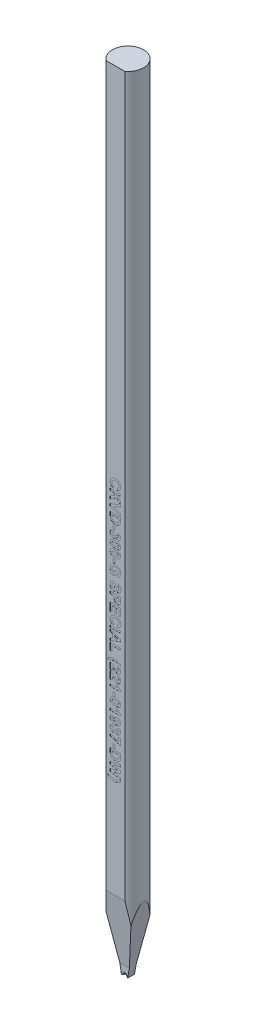
from build123d import *

# Parameters (mm, degrees)
SKETCH_TL_CUTTING_R       = 1.4986
TL_CUTTING_DEPTH          = 75.9968
SKETCH_TDF_GRINDING_W     = 3.0172
SKETCH_TDF_GRINDING_H     = 3.0172
TDF_GRINDING_DEPTH        = 77.026345527
SKETCH_ENGRAVING_W        = 0.166666667
SKETCH_ENGRAVING_H        = 0.371794872
SKETCH_ENGRAVING_W_2      = 1
SKETCH_ENGRAVING_H_2      = 0.192307693
ENGRAVING_DEPTH           = 0.005
VW_VR_GRINDING_DEPTH      = 1.5086
VW_VR_GRINDING_DEPTH_BACK = 1.5086
ISA_GRINDING_DEPTH        = 1.5086
ISA_GRINDING_DEPTH_BACK   = 1.5086
PRE_FRX_BRX_DEPTH         = 1.5086
PRE_FRX_BRX_DEPTH_BACK    = 1.5086
SKETCH_PRE_FRX_BRX_W      = 1.18348
SKETCH_PRE_FRX_BRX_H      = 0.889
FR_EDM_R                  = 0.14986
BR_EDM_R                  = 0.14986
FA_BA_GRINDING_DEPTH      = 1.5086
FA_BA_GRINDING_DEPTH_BACK = 1.5086


with BuildPart() as part:
    # sketch_TL_cutting → TL_cutting (new body)
    with BuildSketch(Plane(origin=(0, 0, 0), x_dir=(1, 0, 0), z_dir=(0, 1, 0))):
        Circle(SKETCH_TL_CUTTING_R)
    extrude(amount=TL_CUTTING_DEPTH)

    # sketch_TDF_grinding → TDF_grinding (cut, through all)
    with BuildSketch(Plane(origin=(0, 0, 0), x_dir=(1, 0, 0), z_dir=(0, 1, 0))):
        with Locations((0, -2.71002)):
            Rectangle(SKETCH_TDF_GRINDING_W, SKETCH_TDF_GRINDING_H)
    extrude(amount=TDF_GRINDING_DEPTH, mode=Mode.SUBTRACT)

    # sketch_engraving → engraving (cut)
    # profile 1 of 31: a face of its own
    with BuildSketch(Plane.XY.offset(1.20142)):
        with BuildLine():
            Line((-0.128205128, 41.054650256), (-0.192307692, 40.862342564))
            add(Edge.make_bspline(
                [(-0.192307692, 40.862342564), (-0.204917923, 40.866249052), (-0.229612721, 40.873899184), (-0.2649877, 40.887977804), (-0.297871332, 40.903972008), (-0.328259475, 40.921799875), (-0.356049464, 40.941535258), (-0.381471598, 40.963029244), (-0.404368127, 40.986493424), (-0.424673345, 41.011910624), (-0.442633936, 41.039003711), (-0.457816548, 41.068096053), (-0.470893242, 41.09875117), (-0.481488041, 41.131280557), (-0.489972889, 41.165468151), (-0.495577171, 41.201474413), (-0.499377062, 41.239130896), (-0.499789062, 41.264843283), (-0.5, 41.278007628)],
                knots=[0, 0, 0, 0, 1.126670901, 2.206376047, 3.246533763, 4.245677351, 5.210506282, 6.152793389, 7.083980095, 8.004497442, 8.926231833, 9.854395169, 10.801995143, 11.768203916, 12.771938831, 13.805609698, 14.87650608, 16, 16, 16, 16], degree=3))
            add(Edge.make_bspline(
                [(-0.5, 41.278007628), (-0.499663994, 41.294256309), (-0.499003061, 41.326217949), (-0.492350465, 41.372959052), (-0.481969511, 41.417500328), (-0.467601869, 41.459909613), (-0.448555271, 41.499888786), (-0.42571373, 41.537813108), (-0.398318662, 41.573249391), (-0.367249987, 41.606390716), (-0.332452821, 41.636519196), (-0.294134751, 41.662512297), (-0.253074131, 41.685050491), (-0.208709772, 41.702976594), (-0.161353037, 41.717061791), (-0.110975156, 41.726908328), (-0.057578507, 41.733074942), (-0.020984357, 41.733777083), (-0.002203526, 41.734137436)],
                knots=[0, 0, 0, 0, 1.025134988, 2.016471176, 2.973446247, 3.909197306, 4.836872559, 5.763618465, 6.698581235, 7.658772073, 8.627106982, 9.597494692, 10.576422683, 11.578339294, 12.6118974, 13.690673505, 14.814808564, 16, 16, 16, 16], degree=3))
            add(Edge.make_bspline(
                [(-0.002203526, 41.734137436), (0.017576475, 41.7337692), (0.056163648, 41.733050839), (0.112313555, 41.727002878), (0.165084042, 41.716956768), (0.214577853, 41.703380058), (0.260470573, 41.685169249), (0.303160692, 41.663313909), (0.342311169, 41.637196152), (0.377833814, 41.607271091), (0.409480853, 41.574137852), (0.437377469, 41.538433428), (0.460593243, 41.499931041), (0.479896446, 41.459107336), (0.494630503, 41.415663397), (0.505304611, 41.369716602), (0.511505561, 41.321246054), (0.512376199, 41.28810808), (0.512820513, 41.271196731)],
                knots=[0, 0, 0, 0, 1.212773307, 2.365899439, 3.458117515, 4.504331001, 5.50806732, 6.480562534, 7.440239902, 8.387651817, 9.323121479, 10.245404239, 11.160468186, 12.07454208, 13.009500751, 13.96802424, 14.963018902, 16, 16, 16, 16], degree=3))
            add(Edge.make_bspline(
                [(0.512820513, 41.271196731), (0.512448361, 41.256427276), (0.511718707, 41.227469796), (0.506761415, 41.185064506), (0.498061698, 41.144876158), (0.486319015, 41.106687521), (0.470821797, 41.070715987), (0.451884357, 41.036897111), (0.429606892, 41.005114651), (0.412205553, 40.985965065), (0.403445513, 40.976324936)],
                knots=[0, 0, 0, 0, 1.098510076, 2.153775193, 3.169777012, 4.153122333, 5.120892526, 6.076995459, 7.031936742, 8, 8, 8, 8], degree=3))
            add(Edge.make_bspline(
                [(0.403445513, 40.976324936), (0.39787141, 40.970737644), (0.386592274, 40.959431818), (0.367549896, 40.944335368), (0.347050772, 40.930022058), (0.324745215, 40.916719068), (0.30046466, 40.904846849), (0.274581981, 40.893834097), (0.246997406, 40.883695069), (0.227800247, 40.878056604), (0.217948718, 40.875163077)],
                knots=[0, 0, 0, 0, 0.885292881, 1.791380647, 2.722937556, 3.69093542, 4.703306561, 5.754477758, 6.847650944, 8, 8, 8, 8], degree=3))
            Line((0.217948718, 40.875163077), (0.179487179, 41.067470769))
            add(Edge.make_bspline(
                [(0.179487179, 41.067470769), (0.1857949, 41.069105288), (0.198219456, 41.072324861), (0.21607256, 41.07883955), (0.233014714, 41.086311208), (0.248625569, 41.0955761), (0.263619506, 41.105402074), (0.277222328, 41.117064773), (0.290109132, 41.129569754), (0.301694454, 41.143458861), (0.312145605, 41.158333589), (0.321339918, 41.174043983), (0.329014435, 41.190628478), (0.335156827, 41.207961754), (0.340319842, 41.225985702), (0.34350638, 41.244872147), (0.345953545, 41.264455752), (0.3460861, 41.277798875), (0.346153846, 41.284618205)],
                knots=[0, 0, 0, 0, 1.051114734, 2.070420253, 3.064047898, 4.034553068, 4.997066449, 5.953344811, 6.921213386, 7.892675544, 8.867420182, 9.852654213, 10.826683617, 11.811917648, 12.818610352, 13.848120519, 14.900229319, 16, 16, 16, 16], degree=3))
            add(Edge.make_bspline(
                [(0.346153846, 41.284618205), (0.345958725, 41.293982256), (0.345576529, 41.31232423), (0.341532101, 41.33905448), (0.335695112, 41.364495692), (0.326982094, 41.38855706), (0.315677399, 41.411171698), (0.302244603, 41.432668905), (0.286035184, 41.452500806), (0.26758257, 41.471139764), (0.246135655, 41.487847721), (0.221779967, 41.502550652), (0.194212535, 41.514744121), (0.163711493, 41.524644409), (0.130202077, 41.532436736), (0.093641969, 41.538001162), (0.054005962, 41.541078434), (0.026581025, 41.541573903), (0.012419872, 41.541829744)],
                knots=[0, 0, 0, 0, 0.93816214, 1.837638998, 2.704791736, 3.551915875, 4.396257554, 5.235807848, 6.087970119, 6.959042444, 7.860386085, 8.80649345, 9.804409709, 10.875695391, 12.017327537, 13.250155505, 14.580089023, 16, 16, 16, 16], degree=3))
            add(Edge.make_bspline(
                [(0.012419872, 41.541829744), (-0.002609028, 41.541576423), (-0.031567402, 41.541088312), (-0.073337178, 41.538011685), (-0.111754322, 41.532411705), (-0.14688701, 41.524722849), (-0.178713725, 41.514772973), (-0.207179389, 41.502599106), (-0.23231734, 41.488126701), (-0.254110839, 41.471378275), (-0.272831387, 41.452777256), (-0.288926796, 41.432827439), (-0.302688307, 41.411646524), (-0.314010391, 41.389107053), (-0.322575422, 41.365123298), (-0.328786932, 41.339892371), (-0.332735688, 41.313321695), (-0.333131326, 41.295115799), (-0.333333333, 41.285820128)],
                knots=[0, 0, 0, 0, 1.475208372, 2.842499301, 4.107722225, 5.282836115, 6.369007568, 7.375918121, 8.315702116, 9.208439171, 10.065831443, 10.90006451, 11.71996243, 12.54067204, 13.369972975, 14.214060185, 15.088124569, 16, 16, 16, 16], degree=3))
            add(Edge.make_bspline(
                [(-0.333333333, 41.285820128), (-0.333161634, 41.278937953), (-0.332824013, 41.265405176), (-0.330681155, 41.245402689), (-0.326591822, 41.22620438), (-0.321184418, 41.207716281), (-0.314399721, 41.189866559), (-0.305696319, 41.17292748), (-0.295693052, 41.156565777), (-0.283969989, 41.14112094), (-0.270808612, 41.126386156), (-0.255597341, 41.112947159), (-0.238701667, 41.100481373), (-0.220008678, 41.089146947), (-0.199678377, 41.07856516), (-0.177394008, 41.069562121), (-0.153515697, 41.061174984), (-0.136789345, 41.056863153), (-0.128205128, 41.054650256)],
                knots=[0, 0, 0, 0, 0.980177776, 1.927374078, 2.859849964, 3.771585772, 4.668674471, 5.574490016, 6.479656464, 7.396337719, 8.332153134, 9.288470092, 10.28125149, 11.318486971, 12.398724812, 13.541284404, 14.738150009, 16, 16, 16, 16], degree=3))
        make_face()
    # profile 2 of 31: a face of its own
    with BuildSketch(Plane.XY.offset(1.20142)):
        Polygon((-0.5, 40.695675897), (0.5, 40.695675897), (0.5, 40.503368205), (0.052283654, 40.503368205), (0.5, 40.081693526), (0.5, 39.817470769), (0.11338141, 40.197278462), (-0.5, 39.804650256), (-0.5, 40.060860192), (-0.035456731, 40.343111795), (-0.198517628, 40.503368205), (-0.5, 40.503368205), align=None)
    # profile 3 of 31: a face of its own
    with BuildSketch(Plane.XY.offset(1.20142)):
        Polygon((-0.5, 39.428448333), (0.5, 39.79824), (0.5, 39.595115), (-0.243589744, 39.330291282), (0.5, 39.066469167), (0.5, 38.862342564), (-0.5, 39.230731987), align=None)
    # profile 4 of 31: a face of its own
    with BuildSketch(Plane.XY.offset(1.20142)):
        with BuildLine():
            Line((0.5, 38.772598974), (0.5, 38.405812115))
            add(Edge.make_bspline(
                [(0.5, 38.405812115), (0.500005193, 38.395794571), (0.500015306, 38.376288084), (0.498840892, 38.347979066), (0.497659587, 38.321506494), (0.495294873, 38.296946352), (0.492816233, 38.274213432), (0.489678088, 38.253266942), (0.485656212, 38.234239202), (0.482484481, 38.222240319), (0.480969551, 38.216509231)],
                knots=[0, 0, 0, 0, 1.259756885, 2.453039283, 3.563158368, 4.591894114, 5.55549294, 6.43918076, 7.254497783, 8, 8, 8, 8], degree=3))
            add(Edge.make_bspline(
                [(0.480969551, 38.216509231), (0.478637325, 38.209340254), (0.474014881, 38.195131431), (0.465827813, 38.174278378), (0.455960096, 38.154444479), (0.445111978, 38.135169819), (0.432903728, 38.116897553), (0.419595761, 38.099182873), (0.404753223, 38.082549803), (0.383633179, 38.06101514), (0.35420815, 38.036590255), (0.315375005, 38.01075972), (0.272594656, 37.989022014), (0.234409605, 37.973830641), (0.20183843, 37.963786542), (0.175754603, 37.957218141), (0.148301213, 37.951546468), (0.119383738, 37.947296292), (0.08913491, 37.943634906), (0.057465542, 37.941007238), (0.024383276, 37.93970625), (0.001870575, 37.939414494), (-0.009615385, 37.939265641)],
                knots=[0, 0, 0, 0, 0.745431882, 1.477436776, 2.212739876, 2.934276521, 3.663147754, 4.384200836, 5.123377481, 5.865761747, 7.365547505, 8.894711587, 10.468722596, 12.101948761, 12.951987285, 13.837595333, 14.760899389, 15.722756883, 16.726861385, 17.773652936, 18.864119771, 20, 20, 20, 20], degree=3))
            add(Edge.make_bspline(
                [(-0.009615385, 37.939265641), (-0.0294616, 37.939657046), (-0.067834928, 37.94041384), (-0.123301552, 37.946011211), (-0.17465514, 37.955306648), (-0.206804138, 37.965017075), (-0.222355769, 37.969714359)],
                knots=[0, 0, 0, 0, 1.103491527, 2.133638164, 3.0971734, 4, 4, 4, 4], degree=3))
            add(Edge.make_bspline(
                [(-0.222355769, 37.969714359), (-0.231274521, 37.972888003), (-0.248819098, 37.979131057), (-0.274127236, 37.990055932), (-0.298211673, 38.001860337), (-0.321053432, 38.014642184), (-0.342549771, 38.028466052), (-0.362636394, 38.043383645), (-0.381577746, 38.059163731), (-0.393236239, 38.07059549), (-0.399038462, 38.076284872)],
                knots=[0, 0, 0, 0, 1.090884612, 2.145940218, 3.175104604, 4.181306866, 5.161203701, 6.118658341, 7.063689906, 8, 8, 8, 8], degree=3))
            add(Edge.make_bspline(
                [(-0.399038462, 38.076284872), (-0.407300305, 38.085571145), (-0.424264154, 38.104638431), (-0.445652736, 38.13798995), (-0.464086504, 38.175865276), (-0.473760833, 38.203179168), (-0.478766026, 38.217310513)],
                knots=[0, 0, 0, 0, 0.912008655, 1.872605891, 2.89935344, 4, 4, 4, 4], degree=3))
            add(Edge.make_bspline(
                [(-0.478766026, 38.217310513), (-0.4805228, 38.223030486), (-0.484168894, 38.234901996), (-0.488062998, 38.253725444), (-0.492165475, 38.273819947), (-0.49463687, 38.295417223), (-0.497243066, 38.318293081), (-0.498706299, 38.342629822), (-0.49974511, 38.368343081), (-0.499913777, 38.385979175), (-0.5, 38.394994808)],
                knots=[0, 0, 0, 0, 0.799129865, 1.658552685, 2.566799617, 3.538529252, 4.561352959, 5.643373779, 6.795284424, 8, 8, 8, 8], degree=3))
            Line((-0.5, 38.394994808), (-0.5, 38.772598974))
            Line((-0.5, 38.772598974), (0.5, 38.772598974))
        make_face()
        with BuildLine():
            Line((0.333333333, 38.580291282), (-0.333333333, 38.580291282))
            Line((-0.333333333, 38.580291282), (-0.333333333, 38.422038077))
            add(Edge.make_bspline(
                [(-0.333333333, 38.422038077), (-0.333276671, 38.41489336), (-0.333167574, 38.401137049), (-0.332847006, 38.381231316), (-0.331979167, 38.362938115), (-0.331080228, 38.346161614), (-0.329595022, 38.33094549), (-0.328134266, 38.317223535), (-0.326090699, 38.305072132), (-0.324477534, 38.297567127), (-0.323717949, 38.294033269)],
                knots=[0, 0, 0, 0, 1.333384787, 2.567275092, 3.714769766, 4.750907381, 5.701951617, 6.567520054, 7.325492842, 8, 8, 8, 8], degree=3))
            add(Edge.make_bspline(
                [(-0.323717949, 38.294033269), (-0.321509316, 38.285756575), (-0.317207482, 38.269635757), (-0.307617456, 38.247000499), (-0.296048139, 38.226518507), (-0.282136533, 38.20784677), (-0.26455548, 38.19101967), (-0.242070693, 38.176655683), (-0.215254411, 38.163362192), (-0.189584523, 38.154258806), (-0.16665678, 38.147724413), (-0.147412959, 38.143301165), (-0.126593091, 38.139805591), (-0.104279343, 38.136798942), (-0.080500412, 38.134369499), (-0.055170426, 38.132857784), (-0.028320392, 38.131826029), (-0.009883527, 38.131659161), (-0.000400641, 38.131573333)],
                knots=[0, 0, 0, 0, 1.038686998, 2.023088296, 2.974059649, 3.888265163, 4.839857954, 5.909819677, 7.113156087, 8.466843969, 9.20827164, 10.006482943, 10.861893492, 11.769681931, 12.739021491, 13.762258324, 14.849031541, 16, 16, 16, 16], degree=3))
            add(Edge.make_bspline(
                [(-0.000400641, 38.131573333), (0.009082275, 38.1316585), (0.027452469, 38.131823485), (0.054102292, 38.132853664), (0.079033415, 38.134356863), (0.102276578, 38.136803691), (0.123864169, 38.139763456), (0.143813574, 38.143300891), (0.161996804, 38.147694423), (0.183589283, 38.154247511), (0.207947697, 38.164084996), (0.23429421, 38.177911199), (0.2571147, 38.194176402), (0.276689574, 38.212531558), (0.29287817, 38.233618569), (0.306422028, 38.256989371), (0.316938162, 38.283120279), (0.321416742, 38.301709318), (0.323717949, 38.311260833)],
                knots=[0, 0, 0, 0, 1.118059345, 2.165891593, 3.144157881, 4.062285166, 4.920717571, 5.712910489, 6.449981617, 7.12489426, 8.371943983, 9.541298068, 10.624898781, 11.666293176, 12.69306237, 13.747704633, 14.842713931, 16, 16, 16, 16], degree=3))
            add(Edge.make_bspline(
                [(0.323717949, 38.311260833), (0.324486218, 38.315395143), (0.326177652, 38.324497311), (0.328151987, 38.339601571), (0.329628909, 38.357388179), (0.331099472, 38.377817116), (0.331977905, 38.400867064), (0.332859431, 38.426572571), (0.333166326, 38.454956851), (0.333276065, 38.474789207), (0.333333333, 38.485139038)],
                knots=[0, 0, 0, 0, 0.578739524, 1.274162912, 2.095457587, 3.035141998, 4.093102578, 5.270121571, 6.575369351, 8, 8, 8, 8], degree=3))
            Line((0.333333333, 38.485139038), (0.333333333, 38.580291282))
        make_face(mode=Mode.SUBTRACT)
    # profile 5 of 31: a face of its own
    with BuildSketch(Plane.XY.offset(1.20142)):
        with Locations((-0.147435898, 37.612342564)):
            Rectangle(SKETCH_ENGRAVING_W, SKETCH_ENGRAVING_H)
    # profile 6 of 31: a face of its own
    with BuildSketch(Plane.XY.offset(1.20142)):
        with BuildLine():
            Line((-0.215945513, 37.362342564), (-0.192307692, 37.170034872))
            add(Edge.make_bspline(
                [(-0.192307692, 37.170034872), (-0.204132194, 37.168374047), (-0.226576764, 37.165221568), (-0.25764429, 37.155392911), (-0.284674848, 37.142559233), (-0.306838708, 37.125577778), (-0.324372016, 37.10595589), (-0.33711688, 37.08413994), (-0.34490548, 37.060107347), (-0.345732378, 37.043356439), (-0.346153846, 37.034818526)],
                knots=[0, 0, 0, 0, 1.266221457, 2.403466716, 3.446976871, 4.428566981, 5.347951143, 6.225000641, 7.095285456, 8, 8, 8, 8], degree=3))
            add(Edge.make_bspline(
                [(-0.346153846, 37.034818526), (-0.346055611, 37.030203461), (-0.345861023, 37.021061738), (-0.343788926, 37.007629506), (-0.340465357, 36.994758943), (-0.335437029, 36.982571108), (-0.329556159, 36.970826661), (-0.32227181, 36.959576899), (-0.313281658, 36.949262443), (-0.303428531, 36.939199798), (-0.292217285, 36.930268114), (-0.280052259, 36.922400902), (-0.267055651, 36.915494907), (-0.252891939, 36.910142089), (-0.237868043, 36.905952024), (-0.221918716, 36.902956531), (-0.205104086, 36.901133476), (-0.193581061, 36.900915398), (-0.187700321, 36.900804103)],
                knots=[0, 0, 0, 0, 0.951793398, 1.885354025, 2.797928458, 3.688489604, 4.600647717, 5.506538063, 6.445271935, 7.419741996, 8.409776722, 9.395967385, 10.406883209, 11.440832221, 12.514165763, 13.622322902, 14.786559767, 16, 16, 16, 16], degree=3))
            add(Edge.make_bspline(
                [(-0.187700321, 36.900804103), (-0.176786947, 36.901222422), (-0.155968497, 36.902020413), (-0.126418152, 36.908146809), (-0.100528778, 36.918853017), (-0.078485293, 36.933531647), (-0.060832569, 36.951320913), (-0.047691388, 36.971330944), (-0.040013472, 36.993554606), (-0.038982665, 37.008987528), (-0.038461538, 37.016789679)],
                knots=[0, 0, 0, 0, 1.241181749, 2.367689556, 3.413199457, 4.409869786, 5.360751057, 6.245864667, 7.113192516, 8, 8, 8, 8], degree=3))
            add(Edge.make_bspline(
                [(-0.038461538, 37.016789679), (-0.038603641, 37.022343112), (-0.038904883, 37.034115803), (-0.04203482, 37.052427586), (-0.046354275, 37.072396665), (-0.050509304, 37.08599409), (-0.052684295, 37.093111795)],
                knots=[0, 0, 0, 0, 0.854525515, 1.811503923, 2.854410343, 4, 4, 4, 4], degree=3))
            Line((-0.052684295, 37.093111795), (0.102564103, 37.075082949))
            add(Edge.make_bspline(
                [(0.102564103, 37.075082949), (0.102472429, 37.069738846), (0.102294537, 37.059368639), (0.103550083, 37.044225032), (0.10584242, 37.03005013), (0.10956176, 37.016877094), (0.114073964, 37.004693353), (0.119743619, 36.99339343), (0.126797738, 36.983249885), (0.137452935, 36.970914156), (0.153346669, 36.958212172), (0.175381237, 36.947159273), (0.200195104, 36.940403806), (0.217704887, 36.939653684), (0.226762821, 36.939265641)],
                knots=[0, 0, 0, 0, 0.916921599, 1.779281976, 2.604591006, 3.377627834, 4.124827521, 4.832199257, 5.541147775, 6.239830602, 7.625300353, 8.999010263, 10.447566839, 12, 12, 12, 12], degree=3))
            add(Edge.make_bspline(
                [(0.226762821, 36.939265641), (0.234476764, 36.939516334), (0.249283176, 36.939997523), (0.270180788, 36.945235916), (0.288882255, 36.953110608), (0.304586758, 36.964738575), (0.317487731, 36.978894609), (0.326781862, 36.995534939), (0.332438867, 37.014428834), (0.333026806, 37.027699453), (0.333333333, 37.034618205)],
                knots=[0, 0, 0, 0, 1.147344735, 2.202253707, 3.191599761, 4.153119954, 5.090433954, 6.026214277, 6.97094964, 8, 8, 8, 8], degree=3))
            add(Edge.make_bspline(
                [(0.333333333, 37.034618205), (0.332987648, 37.041548214), (0.332308151, 37.055170209), (0.325708071, 37.074638134), (0.315274673, 37.092481507), (0.300599014, 37.108350612), (0.282168696, 37.122049405), (0.259890756, 37.133006627), (0.233746812, 37.140438565), (0.214986903, 37.143031309), (0.205128205, 37.144393846)],
                knots=[0, 0, 0, 0, 0.89036141, 1.750142028, 2.61780756, 3.537452052, 4.514848764, 5.561443886, 6.71849122, 8, 8, 8, 8], degree=3))
            Line((0.205128205, 37.144393846), (0.233974359, 37.336701538))
            add(Edge.make_bspline(
                [(0.233974359, 37.336701538), (0.248657574, 37.333532323), (0.276764536, 37.327465734), (0.316129698, 37.315041503), (0.350961973, 37.300551687), (0.381387831, 37.283281655), (0.408215463, 37.263175814), (0.431647434, 37.23945335), (0.452006068, 37.21212244), (0.469141566, 37.181447941), (0.48286138, 37.148078807), (0.493019554, 37.112570657), (0.49884023, 37.075008376), (0.49960808, 37.049328246), (0.5, 37.036220769)],
                knots=[0, 0, 0, 0, 1.22092895, 2.337131514, 3.351677773, 4.283094182, 5.174661873, 6.069250129, 6.984703325, 7.937694494, 8.918809374, 9.912257166, 10.934388599, 12, 12, 12, 12], degree=3))
            add(Edge.make_bspline(
                [(0.5, 37.036220769), (0.499743324, 37.0250556), (0.499240363, 37.003177211), (0.494922998, 36.971182302), (0.487994845, 36.940826892), (0.478138042, 36.912212682), (0.465473847, 36.885270657), (0.449646388, 36.860247035), (0.431514029, 36.83650228), (0.417247021, 36.822516666), (0.41005609, 36.815467564)],
                knots=[0, 0, 0, 0, 1.090586174, 2.137027055, 3.148380755, 4.128502444, 5.088724121, 6.050075692, 7.017189, 8, 8, 8, 8], degree=3))
            add(Edge.make_bspline(
                [(0.41005609, 36.815467564), (0.403937931, 36.810014347), (0.391853934, 36.799243677), (0.372464834, 36.785292563), (0.352400741, 36.773505213), (0.33177098, 36.763951955), (0.310637907, 36.756191566), (0.288816497, 36.750784728), (0.26639464, 36.747489626), (0.251213033, 36.747135679), (0.243589744, 36.746957949)],
                knots=[0, 0, 0, 0, 1.065686435, 2.104841259, 3.101590809, 4.088754543, 5.058798532, 6.025881737, 7.008716709, 8, 8, 8, 8], degree=3))
            add(Edge.make_bspline(
                [(0.243589744, 36.746957949), (0.232867144, 36.747348156), (0.211730927, 36.748117325), (0.180999661, 36.75522324), (0.151856431, 36.7665429), (0.124562561, 36.782597174), (0.09868881, 36.802830588), (0.075169415, 36.828156452), (0.052695262, 36.857402269), (0.04001359, 36.879405891), (0.033453526, 36.890788077)],
                knots=[0, 0, 0, 0, 0.957658001, 1.887720032, 2.804751961, 3.743912922, 4.709136476, 5.731252806, 6.826406682, 8, 8, 8, 8], degree=3))
            add(Edge.make_bspline(
                [(0.033453526, 36.890788077), (0.031822372, 36.884015609), (0.028603533, 36.870651152), (0.022022537, 36.851354744), (0.01367829, 36.833297672), (0.004232675, 36.816115623), (-0.006542103, 36.799905765), (-0.018789165, 36.784713779), (-0.032819972, 36.770996037), (-0.047679673, 36.757892996), (-0.063887586, 36.746343284), (-0.081022983, 36.736311663), (-0.098866636, 36.727626197), (-0.117582182, 36.720614095), (-0.137087229, 36.715173972), (-0.157475267, 36.711446248), (-0.178623511, 36.708933745), (-0.193034825, 36.708643264), (-0.200320513, 36.70849641)],
                knots=[0, 0, 0, 0, 1.03751577, 2.047382676, 3.031239205, 3.997486026, 4.965932412, 5.927662117, 6.898405035, 7.88572577, 8.876798211, 9.857834218, 10.841137353, 11.829660183, 12.831310853, 13.853692922, 14.91492721, 16, 16, 16, 16], degree=3))
            add(Edge.make_bspline(
                [(-0.200320513, 36.70849641), (-0.2109584, 36.708712661), (-0.231937745, 36.709139137), (-0.2626715, 36.714114881), (-0.292387684, 36.721067328), (-0.320688592, 36.731725264), (-0.348018602, 36.744884593), (-0.373770643, 36.761552865), (-0.398719241, 36.780615045), (-0.421838487, 36.802791285), (-0.443209677, 36.82692231), (-0.461662849, 36.853023574), (-0.477734226, 36.880302651), (-0.490419897, 36.909287217), (-0.500667813, 36.939541873), (-0.507459472, 36.971416996), (-0.512114414, 37.004633455), (-0.512582989, 37.027323302), (-0.512820513, 37.038824936)],
                knots=[0, 0, 0, 0, 1.00633359, 1.984625146, 2.941575753, 3.891818189, 4.841976474, 5.80848851, 6.791183869, 7.810935832, 8.837000052, 9.838854168, 10.83333837, 11.829730352, 12.829487178, 13.852742075, 14.911540725, 16, 16, 16, 16], degree=3))
            add(Edge.make_bspline(
                [(-0.512820513, 37.038824936), (-0.512637793, 37.049723744), (-0.51227889, 37.07113157), (-0.508027091, 37.102470842), (-0.501772194, 37.132486869), (-0.492621954, 37.16100445), (-0.481351422, 37.188271997), (-0.466822586, 37.213774845), (-0.450309361, 37.238169476), (-0.430965435, 37.260658893), (-0.409882535, 37.281569186), (-0.386697234, 37.299936375), (-0.362149526, 37.316303988), (-0.336021778, 37.330381702), (-0.308246096, 37.342051545), (-0.278894175, 37.351138132), (-0.248055897, 37.35838486), (-0.226796469, 37.36100515), (-0.215945513, 37.362342564)],
                knots=[0, 0, 0, 0, 1.077528213, 2.11651914, 3.123276654, 4.10732375, 5.075386463, 6.036572488, 7.005896639, 7.98540975, 8.966414275, 9.939311093, 10.906719916, 11.882103104, 12.870994428, 13.882228509, 14.919075059, 16, 16, 16, 16], degree=3))
        make_face()
    # profile 7 of 31: a face of its own
    with BuildSketch(Plane.XY.offset(1.20142)):
        with BuildLine():
            add(Edge.make_bspline(
                [(0.5, 36.266188718), (0.49971384, 36.254284998), (0.499156721, 36.231109821), (0.494192381, 36.197347508), (0.486315205, 36.165594925), (0.474936732, 36.135845943), (0.460535804, 36.107949267), (0.442472771, 36.082297415), (0.421624591, 36.05829643), (0.405435577, 36.044440797), (0.397235577, 36.037422692)],
                knots=[0, 0, 0, 0, 1.098626248, 2.138899374, 3.143835643, 4.113754749, 5.073488057, 6.034745239, 7.004566348, 8, 8, 8, 8], degree=3))
            add(Edge.make_bspline(
                [(0.397235577, 36.037422692), (0.392013767, 36.033407993), (0.381356969, 36.025214695), (0.364136726, 36.01418029), (0.345869985, 36.003571685), (0.326116385, 35.994313442), (0.305221356, 35.985440078), (0.283126793, 35.977249313), (0.259707844, 35.97001695), (0.235071142, 35.963712124), (0.209179241, 35.957818627), (0.181968999, 35.952881398), (0.15350924, 35.948655972), (0.123831018, 35.945360738), (0.092992495, 35.942406339), (0.060842825, 35.940789757), (0.027454838, 35.939465267), (0.004742429, 35.939332949), (-0.006810897, 35.939265641)],
                knots=[0, 0, 0, 0, 0.746775751, 1.524038446, 2.317840886, 3.141016509, 3.996283186, 4.892488336, 5.812382473, 6.774967264, 7.776368117, 8.823659909, 9.910833035, 11.039122168, 12.210293276, 13.424012874, 14.68964937, 16, 16, 16, 16], degree=3))
            add(Edge.make_bspline(
                [(-0.006810897, 35.939265641), (-0.01836425, 35.939331934), (-0.041009977, 35.939461876), (-0.074330982, 35.940794693), (-0.106413621, 35.942407781), (-0.13725379, 35.945353853), (-0.166926114, 35.948680728), (-0.195353975, 35.952786272), (-0.22243919, 35.958104764), (-0.248289812, 35.963911418), (-0.27303117, 35.970176077), (-0.296407841, 35.9777299), (-0.318777777, 35.985590303), (-0.339699687, 35.994669898), (-0.359477735, 36.004260372), (-0.377930928, 36.014711112), (-0.395257891, 36.025868726), (-0.40597091, 36.034141289), (-0.411258013, 36.038223974)],
                knots=[0, 0, 0, 0, 1.308411734, 2.564617834, 3.776541518, 4.94597967, 6.0725993, 7.15816376, 8.197872509, 9.197791611, 10.158952087, 11.086962723, 11.979249638, 12.843171697, 13.668427753, 14.467630577, 15.243743175, 16, 16, 16, 16], degree=3))
            add(Edge.make_bspline(
                [(-0.411258013, 36.038223974), (-0.419387722, 36.045177875), (-0.435436162, 36.058905209), (-0.456111536, 36.082640465), (-0.473801555, 36.1082509), (-0.487914093, 36.136097064), (-0.499368982, 36.165701236), (-0.506993451, 36.197505546), (-0.511967929, 36.231175616), (-0.512532265, 36.254351213), (-0.512820513, 36.266188718)],
                knots=[0, 0, 0, 0, 0.991667276, 1.957599061, 2.911530233, 3.873218945, 4.847995157, 5.850445929, 6.902062539, 8, 8, 8, 8], degree=3))
            add(Edge.make_bspline(
                [(-0.512820513, 36.266188718), (-0.512476011, 36.278161133), (-0.511800941, 36.301621702), (-0.506449472, 36.335875149), (-0.497876451, 36.368434622), (-0.485636462, 36.399183234), (-0.469774335, 36.428076989), (-0.45076002, 36.455341616), (-0.427732542, 36.480383948), (-0.40629523, 36.499989361), (-0.386925042, 36.514332741), (-0.37086259, 36.524449036), (-0.353675124, 36.534225358), (-0.33482528, 36.542663499), (-0.314870578, 36.550988475), (-0.293380967, 36.558361787), (-0.270541238, 36.564866959), (-0.246455682, 36.570974901), (-0.220958398, 36.576068025), (-0.194124629, 36.580752952), (-0.165840258, 36.584444927), (-0.136262825, 36.587718243), (-0.105322509, 36.590022844), (-0.073069943, 36.591894475), (-0.039401887, 36.592832969), (-0.01649349, 36.593017608), (-0.004807692, 36.593111795)],
                knots=[0, 0, 0, 0, 1.257818097, 2.464759732, 3.634271214, 4.790227596, 5.933394726, 7.09190477, 8.274482889, 9.50191983, 10.139172818, 10.805000628, 11.49619854, 12.215266328, 12.973768034, 13.768328009, 14.601232062, 15.469317089, 16.379095881, 17.333267023, 18.331755967, 19.376479622, 20.460535752, 21.592206075, 22.771760786, 24, 24, 24, 24], degree=3))
            add(Edge.make_bspline(
                [(-0.004807692, 36.593111795), (0.006678925, 36.593046), (0.02919122, 36.592917052), (0.062378132, 36.591574948), (0.094328674, 36.589981634), (0.12509981, 36.58700902), (0.154640959, 36.583709515), (0.183004063, 36.579596894), (0.209982531, 36.574178814), (0.235876189, 36.568829743), (0.260431507, 36.562089782), (0.2837906, 36.554664475), (0.306110518, 36.546830136), (0.326924245, 36.537657854), (0.346659803, 36.528122898), (0.365109758, 36.517664838), (0.382437536, 36.506509066), (0.39315045, 36.498236265), (0.3984375, 36.494153462)],
                knots=[0, 0, 0, 0, 1.304443357, 2.556541329, 3.771813033, 4.936929721, 6.066661712, 7.147723817, 8.190304831, 9.191350322, 10.149780912, 11.080355239, 11.975107155, 12.834450748, 13.66198663, 14.463397305, 15.241653965, 16, 16, 16, 16], degree=3))
            add(Edge.make_bspline(
                [(0.3984375, 36.494153462), (0.406566428, 36.487199179), (0.422613323, 36.473471089), (0.443299998, 36.449741361), (0.460913987, 36.424159209), (0.475197493, 36.396394301), (0.486497465, 36.366722107), (0.494183265, 36.334876121), (0.499144648, 36.301200686), (0.499710816, 36.278025839), (0.5, 36.266188718)],
                knots=[0, 0, 0, 0, 0.991631672, 1.957528776, 2.911425699, 3.867574088, 4.848108326, 5.850523106, 6.902101959, 8, 8, 8, 8], degree=3))
        make_face()
        with BuildLine():
            add(Edge.make_bspline(
                [(0.333333333, 36.266188718), (0.333068079, 36.272356684), (0.332548986, 36.284427158), (0.328316127, 36.301982094), (0.321759633, 36.318563165), (0.312130705, 36.334121206), (0.299093083, 36.34852978), (0.281476094, 36.360737658), (0.259881539, 36.371291162), (0.243736, 36.376570771), (0.235176282, 36.379369808)],
                knots=[0, 0, 0, 0, 0.909107913, 1.77908945, 2.650019014, 3.530482969, 4.465025013, 5.495890128, 6.672421267, 8, 8, 8, 8], degree=3))
            add(Edge.make_bspline(
                [(0.235176282, 36.379369808), (0.228718042, 36.381117997), (0.214837576, 36.384875317), (0.192206647, 36.38913972), (0.166522939, 36.392656485), (0.137792419, 36.395626038), (0.105999886, 36.398042628), (0.071125109, 36.399530848), (0.033192525, 36.400559478), (0.006878451, 36.400720391), (-0.006810897, 36.400804103)],
                knots=[0, 0, 0, 0, 0.658986521, 1.416336438, 2.266694271, 3.212608458, 4.261595115, 5.407496572, 6.651304179, 8, 8, 8, 8], degree=3))
            add(Edge.make_bspline(
                [(-0.006810897, 36.400804103), (-0.020433943, 36.400813117), (-0.046549094, 36.400830397), (-0.084006477, 36.399656163), (-0.118154033, 36.39848872), (-0.148991056, 36.396119061), (-0.176626244, 36.393780892), (-0.200847568, 36.390243343), (-0.221857789, 36.386690608), (-0.244486895, 36.380657153), (-0.268257705, 36.372341394), (-0.292448985, 36.361112977), (-0.311537375, 36.348447058), (-0.325415776, 36.333915587), (-0.334597404, 36.318170329), (-0.341538269, 36.301866395), (-0.345246665, 36.284314555), (-0.345848983, 36.272280013), (-0.346153846, 36.266188718)],
                knots=[0, 0, 0, 0, 1.613038927, 3.092168624, 4.43749063, 5.658264602, 6.75425577, 7.720394221, 8.556328411, 9.275513998, 10.490872946, 11.534172084, 12.42681833, 13.187531851, 13.88996177, 14.574222125, 15.278341114, 16, 16, 16, 16], degree=3))
            add(Edge.make_bspline(
                [(-0.346153846, 36.266188718), (-0.345874419, 36.26009088), (-0.345321688, 36.248028799), (-0.341225408, 36.230496833), (-0.334465655, 36.213939336), (-0.325029126, 36.198276493), (-0.311901617, 36.18385441), (-0.294300445, 36.171637614), (-0.272700888, 36.16108693), (-0.25655611, 36.155806893), (-0.247996795, 36.153007628)],
                knots=[0, 0, 0, 0, 0.899391665, 1.779078861, 2.640979247, 3.529945348, 4.464599804, 5.495588918, 6.672261578, 8, 8, 8, 8], degree=3))
            add(Edge.make_bspline(
                [(-0.247996795, 36.153007628), (-0.241538043, 36.151261968), (-0.227719754, 36.147527186), (-0.205229709, 36.143232396), (-0.179679092, 36.13970611), (-0.151079269, 36.136764791), (-0.11935541, 36.134324431), (-0.084546407, 36.132848845), (-0.046680798, 36.131819247), (-0.020433482, 36.131657356), (-0.006810897, 36.131573333)],
                knots=[0, 0, 0, 0, 0.66114423, 1.414496391, 2.261103113, 3.210114492, 4.255954433, 5.405607896, 6.653488082, 8, 8, 8, 8], degree=3))
            add(Edge.make_bspline(
                [(-0.006810897, 36.131573333), (0.006810741, 36.131687109), (0.032921137, 36.131905199), (0.070464093, 36.132532091), (0.104645163, 36.134287006), (0.13553417, 36.136043226), (0.163028833, 36.139008631), (0.187277888, 36.141951537), (0.208178651, 36.146023667), (0.23096624, 36.151615697), (0.254848985, 36.15995368), (0.278913284, 36.17152584), (0.298191428, 36.18396291), (0.312146257, 36.198469879), (0.321683592, 36.214188044), (0.328364426, 36.230640374), (0.332523972, 36.248089531), (0.333060584, 36.26008941), (0.333333333, 36.266188718)],
                knots=[0, 0, 0, 0, 1.611458614, 3.088895909, 4.441089836, 5.660086535, 6.747875232, 7.711965119, 8.548505902, 9.26500436, 10.486583113, 11.532259092, 12.419544583, 13.184925779, 13.890764661, 14.581638641, 15.279074115, 16, 16, 16, 16], degree=3))
        make_face(mode=Mode.SUBTRACT)
    # profile 8 of 31: a face of its own
    with BuildSketch(Plane.XY.offset(1.20142)):
        with BuildLine():
            add(Edge.make_bspline(
                [(0.5, 35.496957949), (0.49971384, 35.485054229), (0.499156721, 35.461879051), (0.494192381, 35.428116739), (0.486315205, 35.396364156), (0.474936732, 35.366615173), (0.460535804, 35.338718497), (0.442472771, 35.313066646), (0.421624591, 35.289065661), (0.405435577, 35.275210028), (0.397235577, 35.268191923)],
                knots=[0, 0, 0, 0, 1.098626248, 2.138899374, 3.143835643, 4.113754749, 5.073488057, 6.034745239, 7.004566348, 8, 8, 8, 8], degree=3))
            add(Edge.make_bspline(
                [(0.397235577, 35.268191923), (0.392013767, 35.264177224), (0.381356969, 35.255983926), (0.364136726, 35.24494952), (0.345869985, 35.234340915), (0.326116385, 35.225082673), (0.305221356, 35.216209309), (0.283126793, 35.208018544), (0.259707844, 35.20078618), (0.235071142, 35.194481354), (0.209179241, 35.188587858), (0.181968999, 35.183650628), (0.15350924, 35.179425203), (0.123831018, 35.176129969), (0.092992495, 35.17317557), (0.060842825, 35.171558988), (0.027454838, 35.170234498), (0.004742429, 35.170102179), (-0.006810897, 35.170034872)],
                knots=[0, 0, 0, 0, 0.746775751, 1.524038446, 2.317840886, 3.141016509, 3.996283186, 4.892488336, 5.812382473, 6.774967264, 7.776368117, 8.823659909, 9.910833035, 11.039122168, 12.210293276, 13.424012874, 14.68964937, 16, 16, 16, 16], degree=3))
            add(Edge.make_bspline(
                [(-0.006810897, 35.170034872), (-0.01836425, 35.170101165), (-0.041009977, 35.170231107), (-0.074330982, 35.171563924), (-0.106413621, 35.173177012), (-0.13725379, 35.176123084), (-0.166926114, 35.179449959), (-0.195353975, 35.183555503), (-0.22243919, 35.188873995), (-0.248289812, 35.194680649), (-0.27303117, 35.200945308), (-0.296407841, 35.208499131), (-0.318777777, 35.216359533), (-0.339699687, 35.225439129), (-0.359477735, 35.235029602), (-0.377930928, 35.245480342), (-0.395257891, 35.256637957), (-0.40597091, 35.26491052), (-0.411258013, 35.268993205)],
                knots=[0, 0, 0, 0, 1.308411734, 2.564617834, 3.776541518, 4.94597967, 6.0725993, 7.15816376, 8.197872509, 9.197791611, 10.158952087, 11.086962723, 11.979249638, 12.843171697, 13.668427753, 14.467630577, 15.243743175, 16, 16, 16, 16], degree=3))
            add(Edge.make_bspline(
                [(-0.411258013, 35.268993205), (-0.419387722, 35.275947105), (-0.435436162, 35.28967444), (-0.456111536, 35.313409695), (-0.473801555, 35.339020131), (-0.487914093, 35.366866295), (-0.499368982, 35.396470467), (-0.506993451, 35.428274777), (-0.511967929, 35.461944847), (-0.512532265, 35.485120444), (-0.512820513, 35.496957949)],
                knots=[0, 0, 0, 0, 0.991667276, 1.957599061, 2.911530233, 3.873218945, 4.847995157, 5.850445929, 6.902062539, 8, 8, 8, 8], degree=3))
            add(Edge.make_bspline(
                [(-0.512820513, 35.496957949), (-0.512476011, 35.508930364), (-0.511800941, 35.532390933), (-0.506449472, 35.566644379), (-0.497876451, 35.599203853), (-0.485636462, 35.629952465), (-0.469774335, 35.65884622), (-0.45076002, 35.686110847), (-0.427732542, 35.711153179), (-0.40629523, 35.730758592), (-0.386925042, 35.745101971), (-0.37086259, 35.755218267), (-0.353675124, 35.764994589), (-0.33482528, 35.77343273), (-0.314870578, 35.781757706), (-0.293380967, 35.789131018), (-0.270541238, 35.79563619), (-0.246455682, 35.801744132), (-0.220958398, 35.806837256), (-0.194124629, 35.811522183), (-0.165840258, 35.815214157), (-0.136262825, 35.818487473), (-0.105322509, 35.820792075), (-0.073069943, 35.822663706), (-0.039401887, 35.8236022), (-0.01649349, 35.823786839), (-0.004807692, 35.823881026)],
                knots=[0, 0, 0, 0, 1.257818097, 2.464759732, 3.634271214, 4.790227596, 5.933394726, 7.09190477, 8.274482889, 9.50191983, 10.139172818, 10.805000628, 11.49619854, 12.215266328, 12.973768034, 13.768328009, 14.601232062, 15.469317089, 16.379095881, 17.333267023, 18.331755967, 19.376479622, 20.460535752, 21.592206075, 22.771760786, 24, 24, 24, 24], degree=3))
            add(Edge.make_bspline(
                [(-0.004807692, 35.823881026), (0.006678925, 35.823815231), (0.02919122, 35.823686282), (0.062378132, 35.822344179), (0.094328674, 35.820750865), (0.12509981, 35.817778251), (0.154640959, 35.814478746), (0.183004063, 35.810366125), (0.209982531, 35.804948045), (0.235876189, 35.799598974), (0.260431507, 35.792859013), (0.2837906, 35.785433706), (0.306110518, 35.777599367), (0.326924245, 35.768427084), (0.346659803, 35.758892128), (0.365109758, 35.748434069), (0.382437536, 35.737278297), (0.39315045, 35.729005495), (0.3984375, 35.724922692)],
                knots=[0, 0, 0, 0, 1.304443357, 2.556541329, 3.771813033, 4.936929721, 6.066661712, 7.147723817, 8.190304831, 9.191350322, 10.149780912, 11.080355239, 11.975107155, 12.834450748, 13.66198663, 14.463397305, 15.241653965, 16, 16, 16, 16], degree=3))
            add(Edge.make_bspline(
                [(0.3984375, 35.724922692), (0.406566428, 35.71796841), (0.422613323, 35.70424032), (0.443299998, 35.680510592), (0.460913987, 35.654928439), (0.475197493, 35.627163532), (0.486497465, 35.597491338), (0.494183265, 35.565645352), (0.499144648, 35.531969916), (0.499710816, 35.50879507), (0.5, 35.496957949)],
                knots=[0, 0, 0, 0, 0.991631672, 1.957528776, 2.911425699, 3.867574088, 4.848108326, 5.850523106, 6.902101959, 8, 8, 8, 8], degree=3))
        make_face()
        with BuildLine():
            add(Edge.make_bspline(
                [(0.333333333, 35.496957949), (0.333068079, 35.503125915), (0.332548986, 35.515196389), (0.328316127, 35.532751325), (0.321759633, 35.549332396), (0.312130705, 35.564890436), (0.299093083, 35.579299011), (0.281476094, 35.591506888), (0.259881539, 35.602060392), (0.243736, 35.607340001), (0.235176282, 35.610139038)],
                knots=[0, 0, 0, 0, 0.909107913, 1.77908945, 2.650019014, 3.530482969, 4.465025013, 5.495890128, 6.672421267, 8, 8, 8, 8], degree=3))
            add(Edge.make_bspline(
                [(0.235176282, 35.610139038), (0.228718042, 35.611887227), (0.214837576, 35.615644548), (0.192206647, 35.619908951), (0.166522939, 35.623425716), (0.137792419, 35.626395269), (0.105999886, 35.628811859), (0.071125109, 35.630300078), (0.033192525, 35.631328709), (0.006878451, 35.631489622), (-0.006810897, 35.631573333)],
                knots=[0, 0, 0, 0, 0.658986521, 1.416336438, 2.266694271, 3.212608458, 4.261595115, 5.407496572, 6.651304179, 8, 8, 8, 8], degree=3))
            add(Edge.make_bspline(
                [(-0.006810897, 35.631573333), (-0.020433943, 35.631582347), (-0.046549094, 35.631599627), (-0.084006477, 35.630425394), (-0.118154033, 35.629257951), (-0.148991056, 35.626888292), (-0.176626244, 35.624550123), (-0.200847568, 35.621012574), (-0.221857789, 35.617459839), (-0.244486895, 35.611426384), (-0.268257705, 35.603110625), (-0.292448985, 35.591882207), (-0.311537375, 35.579216289), (-0.325415776, 35.564684818), (-0.334597404, 35.54893956), (-0.341538269, 35.532635625), (-0.345246665, 35.515083786), (-0.345848983, 35.503049244), (-0.346153846, 35.496957949)],
                knots=[0, 0, 0, 0, 1.613038927, 3.092168624, 4.43749063, 5.658264602, 6.75425577, 7.720394221, 8.556328411, 9.275513998, 10.490872946, 11.534172084, 12.42681833, 13.187531851, 13.88996177, 14.574222125, 15.278341114, 16, 16, 16, 16], degree=3))
            add(Edge.make_bspline(
                [(-0.346153846, 35.496957949), (-0.345874419, 35.490860111), (-0.345321688, 35.47879803), (-0.341225408, 35.461266063), (-0.334465655, 35.444708567), (-0.325029126, 35.429045723), (-0.311901617, 35.414623641), (-0.294300445, 35.402406845), (-0.272700888, 35.391856161), (-0.25655611, 35.386576123), (-0.247996795, 35.383776859)],
                knots=[0, 0, 0, 0, 0.899391665, 1.779078861, 2.640979247, 3.529945348, 4.464599804, 5.495588918, 6.672261578, 8, 8, 8, 8], degree=3))
            add(Edge.make_bspline(
                [(-0.247996795, 35.383776859), (-0.241538043, 35.382031199), (-0.227719754, 35.378296417), (-0.205229709, 35.374001627), (-0.179679092, 35.37047534), (-0.151079269, 35.367534022), (-0.11935541, 35.365093662), (-0.084546407, 35.363618076), (-0.046680798, 35.362588478), (-0.020433482, 35.362426587), (-0.006810897, 35.362342564)],
                knots=[0, 0, 0, 0, 0.66114423, 1.414496391, 2.261103113, 3.210114492, 4.255954433, 5.405607896, 6.653488082, 8, 8, 8, 8], degree=3))
            add(Edge.make_bspline(
                [(-0.006810897, 35.362342564), (0.006810741, 35.36245634), (0.032921137, 35.36267443), (0.070464093, 35.363301322), (0.104645163, 35.365056237), (0.13553417, 35.366812457), (0.163028833, 35.369777861), (0.187277888, 35.372720768), (0.208178651, 35.376792897), (0.23096624, 35.382384928), (0.254848985, 35.39072291), (0.278913284, 35.402295071), (0.298191428, 35.414732141), (0.312146257, 35.42923911), (0.321683592, 35.444957274), (0.328364426, 35.461409605), (0.332523972, 35.478858762), (0.333060584, 35.490858641), (0.333333333, 35.496957949)],
                knots=[0, 0, 0, 0, 1.611458614, 3.088895909, 4.441089836, 5.660086535, 6.747875232, 7.711965119, 8.548505902, 9.26500436, 10.486583113, 11.532259092, 12.419544583, 13.184925779, 13.890764661, 14.581638641, 15.279074115, 16, 16, 16, 16], degree=3))
        make_face(mode=Mode.SUBTRACT)
    # profile 9 of 31: a face of its own
    with BuildSketch(Plane.XY.offset(1.20142)):
        with Locations((-0.147435898, 34.843111795)):
            Rectangle(SKETCH_ENGRAVING_W, SKETCH_ENGRAVING_H)
    # profile 10 of 31: a face of its own
    with BuildSketch(Plane.XY.offset(1.20142)):
        with BuildLine():
            Line((-0.128205128, 34.093111795), (0.038461538, 34.093111795))
            Line((0.038461538, 34.093111795), (0.038461538, 33.657214359))
            Line((0.038461538, 33.657214359), (-0.36338141, 33.657214359))
            add(Edge.make_bspline(
                [(-0.36338141, 33.657214359), (-0.368321434, 33.662700375), (-0.378419843, 33.6739149), (-0.392661125, 33.692212664), (-0.406257259, 33.712356779), (-0.4194836, 33.734225469), (-0.432233696, 33.757863992), (-0.444685123, 33.783178064), (-0.45671611, 33.810214391), (-0.471787381, 33.848447711), (-0.488186169, 33.89766183), (-0.502445448, 33.957827076), (-0.511191227, 34.018468267), (-0.512277771, 34.059029075), (-0.512820513, 34.079289679)],
                knots=[0, 0, 0, 0, 0.581799769, 1.189316438, 1.825828404, 2.496525428, 3.203088405, 3.942228803, 4.719818701, 5.534979611, 7.181138583, 8.803804008, 10.403462225, 12, 12, 12, 12], degree=3))
            add(Edge.make_bspline(
                [(-0.512820513, 34.079289679), (-0.512629241, 34.091982166), (-0.512252188, 34.117002831), (-0.509233571, 34.153941118), (-0.504017902, 34.189658224), (-0.496780719, 34.224090736), (-0.487836372, 34.257341646), (-0.476607913, 34.289294166), (-0.463065488, 34.319914068), (-0.447986133, 34.349430581), (-0.430657849, 34.377283177), (-0.411724289, 34.403527023), (-0.390891397, 34.427907404), (-0.36853351, 34.450636217), (-0.344060025, 34.471284803), (-0.318106216, 34.490366641), (-0.290219674, 34.507425038), (-0.260879177, 34.522751559), (-0.230317098, 34.536380942), (-0.198781008, 34.547883246), (-0.166726875, 34.557966922), (-0.134042675, 34.566254707), (-0.10062201, 34.572341654), (-0.066619552, 34.577073529), (-0.031822841, 34.579615004), (-0.008417054, 34.580064325), (0.003405449, 34.580291282)],
                knots=[0, 0, 0, 0, 1.124897971, 2.217508473, 3.282174662, 4.322209414, 5.334422951, 6.332119154, 7.320662553, 8.300074908, 9.267468154, 10.225199689, 11.165658754, 12.107290334, 13.047749399, 14.00069605, 14.959944213, 15.942088746, 16.933021067, 17.923599838, 18.915715637, 19.910475908, 20.909926025, 21.925232038, 22.952013513, 24, 24, 24, 24], degree=3))
            add(Edge.make_bspline(
                [(0.003405449, 34.580291282), (0.016165747, 34.580107383), (0.041321811, 34.579744838), (0.078501182, 34.576615194), (0.114594914, 34.571767239), (0.149519517, 34.564372247), (0.183523729, 34.555518796), (0.216299841, 34.544174109), (0.248180515, 34.531220661), (0.278688999, 34.515936543), (0.308028284, 34.499053971), (0.335510174, 34.4798704), (0.361403632, 34.4590508), (0.385591047, 34.436407968), (0.407627145, 34.411569007), (0.428063784, 34.385043308), (0.447146094, 34.35684846), (0.457908016, 34.336671736), (0.463341346, 34.326485192)],
                knots=[0, 0, 0, 0, 1.105132952, 2.178694671, 3.229818344, 4.257558797, 5.269123684, 6.27148554, 7.259679084, 8.247804916, 9.224967877, 10.189258471, 11.147685264, 12.101072275, 13.055511435, 14.02039165, 15.000562851, 16, 16, 16, 16], degree=3))
            add(Edge.make_bspline(
                [(0.463341346, 34.326485192), (0.467347168, 34.318397841), (0.475455657, 34.302027618), (0.485329628, 34.275954525), (0.494054347, 34.248586948), (0.500719187, 34.219605473), (0.506115234, 34.189318993), (0.510216979, 34.157577917), (0.512307439, 34.124323708), (0.512647258, 34.101661284), (0.512820513, 34.090106987)],
                knots=[0, 0, 0, 0, 0.887950456, 1.797368171, 2.741221183, 3.713797788, 4.722103116, 5.768966405, 6.862521341, 8, 8, 8, 8], degree=3))
            add(Edge.make_bspline(
                [(0.512820513, 34.090106987), (0.512598613, 34.075209487), (0.512167059, 34.046236604), (0.508571106, 34.00399631), (0.502373597, 33.964242674), (0.493837942, 33.926920334), (0.482863355, 33.892109697), (0.469371425, 33.859870687), (0.453633675, 33.830005429), (0.435019378, 33.802946485), (0.414494937, 33.778143918), (0.392035387, 33.755662449), (0.367607461, 33.735493031), (0.341334074, 33.717622318), (0.313106625, 33.702190967), (0.283182558, 33.688922952), (0.251334696, 33.678001769), (0.22921692, 33.672723803), (0.217948718, 33.670034872)],
                knots=[0, 0, 0, 0, 1.271135529, 2.472123572, 3.614091059, 4.701890498, 5.736279567, 6.724681829, 7.680621489, 8.611506429, 9.52200816, 10.424540711, 11.318996785, 12.221421405, 13.131851814, 14.060431888, 15.011860567, 16, 16, 16, 16], degree=3))
            Line((0.217948718, 33.670034872), (0.179487179, 33.862342564))
            add(Edge.make_bspline(
                [(0.179487179, 33.862342564), (0.185798707, 33.864245146), (0.198251232, 33.867998905), (0.216108293, 33.875305481), (0.232994438, 33.883623603), (0.248643132, 33.893450597), (0.263649233, 33.903888251), (0.277161531, 33.916158435), (0.290187329, 33.929065453), (0.301701762, 33.943556609), (0.312086782, 33.958995164), (0.321450083, 33.975216632), (0.329043783, 33.992584974), (0.335153652, 34.010857597), (0.340342569, 34.029945002), (0.343533767, 34.05009634), (0.345940549, 34.0710853), (0.346081986, 34.085425325), (0.346153846, 34.092711154)],
                knots=[0, 0, 0, 0, 1.027780279, 2.027791312, 3.006028774, 3.96000864, 4.908113241, 5.852721087, 6.802883308, 7.765918715, 8.733730415, 9.704005314, 10.683351261, 11.68471758, 12.707948499, 13.764514378, 14.864202456, 16, 16, 16, 16], degree=3))
            add(Edge.make_bspline(
                [(0.346153846, 34.092711154), (0.345859633, 34.103738511), (0.34528545, 34.125259337), (0.341538784, 34.156676876), (0.334873123, 34.186316442), (0.325679114, 34.21425554), (0.313877959, 34.240545391), (0.299029501, 34.264830737), (0.282012344, 34.28771627), (0.262039987, 34.308550747), (0.239645267, 34.32744525), (0.214561065, 34.343801822), (0.186868462, 34.357418599), (0.156706511, 34.368571515), (0.124073954, 34.377451616), (0.088855272, 34.383475764), (0.051104495, 34.387411833), (0.02505068, 34.387789093), (0.01161859, 34.38798359)],
                knots=[0, 0, 0, 0, 1.043810997, 2.037086103, 2.989314757, 3.91471467, 4.817033861, 5.710208705, 6.603920097, 7.511448416, 8.435617211, 9.371747005, 10.338444094, 11.350425613, 12.411431869, 13.5347293, 14.729025275, 16, 16, 16, 16], degree=3))
            add(Edge.make_bspline(
                [(0.01161859, 34.38798359), (-0.002813331, 34.387780916), (-0.03086261, 34.387387007), (-0.071503034, 34.383552106), (-0.109371212, 34.377253885), (-0.14440027, 34.368186527), (-0.176807311, 34.356879264), (-0.206438048, 34.342899735), (-0.233109204, 34.326091899), (-0.256980675, 34.307029064), (-0.278169336, 34.285992253), (-0.296147735, 34.262929293), (-0.31184176, 34.238671086), (-0.32420794, 34.212531286), (-0.33413508, 34.184982798), (-0.341078682, 34.155756769), (-0.345395871, 34.124958498), (-0.345897627, 34.103876945), (-0.346153846, 34.093111795)],
                knots=[0, 0, 0, 0, 1.31821493, 2.562027667, 3.72541598, 4.821825939, 5.863743127, 6.857000185, 7.808227391, 8.737146514, 9.643023621, 10.529087527, 11.404035307, 12.277173472, 13.164790074, 14.074766194, 15.016892606, 16, 16, 16, 16], degree=3))
            add(Edge.make_bspline(
                [(-0.346153846, 34.093111795), (-0.345850315, 34.082208504), (-0.34524035, 34.060297617), (-0.340086045, 34.027476537), (-0.332449955, 33.994476283), (-0.321065283, 33.962083933), (-0.307937779, 33.930697225), (-0.292687307, 33.901531024), (-0.276962331, 33.874138447), (-0.264654274, 33.857625969), (-0.258613782, 33.849522051)],
                knots=[0, 0, 0, 0, 0.993779204, 1.997065276, 3.023588959, 4.078879359, 5.123947549, 6.123456565, 7.079038607, 8, 8, 8, 8], degree=3))
            Line((-0.258613782, 33.849522051), (-0.128205128, 33.849522051))
            Line((-0.128205128, 33.849522051), (-0.128205128, 34.093111795))
        make_face()
    # profile 11 of 31: a face of its own
    with BuildSketch(Plane.XY.offset(1.20142)):
        with BuildLine():
            Line((-0.166666667, 33.131573333), (-0.153846154, 32.939265641))
            add(Edge.make_bspline(
                [(-0.153846154, 32.939265641), (-0.161891279, 32.937732992), (-0.177518424, 32.934755918), (-0.199795017, 32.928152009), (-0.220541784, 32.920845841), (-0.239662803, 32.912232964), (-0.25710555, 32.902367896), (-0.273156714, 32.891577618), (-0.28732832, 32.879334862), (-0.299925293, 32.866003176), (-0.310783278, 32.851429999), (-0.320246275, 32.835729399), (-0.328256178, 32.818808131), (-0.334922245, 32.800730819), (-0.339885492, 32.781317406), (-0.343420115, 32.760749762), (-0.345682646, 32.738994761), (-0.345994208, 32.724127096), (-0.346153846, 32.716509231)],
                knots=[0, 0, 0, 0, 1.20477517, 2.340199137, 3.415898527, 4.440826703, 5.422227366, 6.362763262, 7.28278988, 8.172822029, 9.057410505, 9.952475558, 10.866920142, 11.809098, 12.784128911, 13.811833846, 14.878831738, 16, 16, 16, 16], degree=3))
            add(Edge.make_bspline(
                [(-0.346153846, 32.716509231), (-0.346066367, 32.708490933), (-0.345896216, 32.692894929), (-0.343785338, 32.670294596), (-0.340761278, 32.649162259), (-0.335974263, 32.629684522), (-0.330620744, 32.611497658), (-0.323296559, 32.595053353), (-0.314849171, 32.580085499), (-0.305263574, 32.566632657), (-0.294632459, 32.554892348), (-0.28353392, 32.544621341), (-0.272207737, 32.535675972), (-0.260151301, 32.528635334), (-0.247852227, 32.522937439), (-0.234943611, 32.51917153), (-0.221721863, 32.516627435), (-0.212685699, 32.516335702), (-0.208133013, 32.516188718)],
                knots=[0, 0, 0, 0, 1.417779877, 2.757654889, 4.012140507, 5.189587551, 6.302846416, 7.360586765, 8.365575446, 9.33904572, 10.275781718, 11.161696098, 12.012180333, 12.822428111, 13.625933072, 14.403138519, 15.195454004, 16, 16, 16, 16], degree=3))
            add(Edge.make_bspline(
                [(-0.208133013, 32.516188718), (-0.202439146, 32.516482996), (-0.191320796, 32.517057629), (-0.175220679, 32.520827928), (-0.160658688, 32.527632431), (-0.147071392, 32.536868971), (-0.134926522, 32.549833369), (-0.123459543, 32.566237524), (-0.11316916, 32.586697237), (-0.107424402, 32.601865842), (-0.104366987, 32.609938718)],
                knots=[0, 0, 0, 0, 0.906150226, 1.7694295, 2.610923838, 3.450874087, 4.367551936, 5.419872502, 6.626831617, 8, 8, 8, 8], degree=3))
            add(Edge.make_bspline(
                [(-0.104366987, 32.609938718), (-0.103205903, 32.613402905), (-0.100607587, 32.621155194), (-0.096897182, 32.634381154), (-0.092218385, 32.650366556), (-0.087052561, 32.669259979), (-0.081545375, 32.691022885), (-0.074955523, 32.715448532), (-0.068334023, 32.742907832), (-0.063456004, 32.762120895), (-0.060897436, 32.772198333)],
                knots=[0, 0, 0, 0, 0.521824192, 1.167757792, 1.961731518, 2.901193269, 3.965386864, 5.168422915, 6.514810244, 8, 8, 8, 8], degree=3))
            add(Edge.make_bspline(
                [(-0.060897436, 32.772198333), (-0.0576208, 32.785321849), (-0.051299067, 32.810641528), (-0.040053153, 32.846753187), (-0.028879714, 32.880012685), (-0.016755933, 32.910099788), (-0.004503472, 32.937346368), (0.008737874, 32.961311704), (0.022280434, 32.9824959), (0.032402475, 32.994840422), (0.037259615, 33.000764038)],
                knots=[0, 0, 0, 0, 1.293880989, 2.496331788, 3.617634808, 4.64976062, 5.598842568, 6.473791081, 7.267636666, 8, 8, 8, 8], degree=3))
            add(Edge.make_bspline(
                [(0.037259615, 33.000764038), (0.044137694, 33.008110092), (0.057622804, 33.022512711), (0.079781426, 33.041471522), (0.103188466, 33.057402086), (0.127671148, 33.070514684), (0.153370416, 33.080611137), (0.180114252, 33.087767373), (0.207972454, 33.092399148), (0.22694455, 33.092871789), (0.236578526, 33.093111795)],
                knots=[0, 0, 0, 0, 1.064429417, 2.086912298, 3.078678339, 4.055528992, 5.020032834, 5.993708893, 6.981211098, 8, 8, 8, 8], degree=3))
            add(Edge.make_bspline(
                [(0.236578526, 33.093111795), (0.249044725, 33.092644331), (0.273773943, 33.091717024), (0.310123415, 33.08321467), (0.34519423, 33.06996628), (0.373053378, 33.054613891), (0.394102454, 33.039835366), (0.409316468, 33.027608713), (0.423234984, 33.013918899), (0.436363342, 32.999257469), (0.448421192, 32.983378333), (0.459337354, 32.966261959), (0.469762031, 32.948230204), (0.481724432, 32.921917828), (0.494501972, 32.886386959), (0.505216674, 32.840151911), (0.511620444, 32.789806137), (0.512410831, 32.754856875), (0.512820513, 32.736741603)],
                knots=[0, 0, 0, 0, 1.180224575, 2.341213254, 3.519178081, 4.726056898, 5.344182394, 5.956118988, 6.573855441, 7.192564044, 7.82049682, 8.461345463, 9.116141012, 9.79299132, 11.198532007, 12.687823846, 14.283197644, 16, 16, 16, 16], degree=3))
            add(Edge.make_bspline(
                [(0.512820513, 32.736741603), (0.512622915, 32.721908568), (0.512238592, 32.693058634), (0.508327094, 32.651240661), (0.502300976, 32.612232321), (0.493471523, 32.576097475), (0.482080613, 32.542768087), (0.468307987, 32.512179204), (0.4520288, 32.484411205), (0.433078398, 32.459759232), (0.412189308, 32.437795993), (0.389371716, 32.418636757), (0.364914548, 32.402208024), (0.338835479, 32.388403833), (0.311000478, 32.377563434), (0.281444264, 32.36960159), (0.250236407, 32.364335557), (0.228852471, 32.36301561), (0.217948718, 32.362342564)],
                knots=[0, 0, 0, 0, 1.325136797, 2.577362738, 3.74962816, 4.849499017, 5.896771726, 6.892816139, 7.842473141, 8.766187929, 9.665133525, 10.546015357, 11.42313021, 12.293255665, 13.177485873, 14.086514152, 15.024305989, 16, 16, 16, 16], degree=3))
            Line((0.217948718, 32.362342564), (0.205128205, 32.554650256))
            add(Edge.make_bspline(
                [(0.205128205, 32.554650256), (0.211158714, 32.555759181), (0.22291155, 32.557920361), (0.239739753, 32.562627468), (0.255319488, 32.567908235), (0.269550394, 32.574174545), (0.282452554, 32.581392876), (0.29405422, 32.589597056), (0.304442868, 32.598632928), (0.313348905, 32.608881396), (0.321255295, 32.62010557), (0.327770309, 32.632732058), (0.333732615, 32.646370184), (0.338229411, 32.661531156), (0.341791978, 32.67794001), (0.344434282, 32.695601538), (0.34572413, 32.714553752), (0.346007328, 32.727592118), (0.346153846, 32.734337756)],
                knots=[0, 0, 0, 0, 1.150775252, 2.242741279, 3.277646382, 4.23752694, 5.158201782, 6.048759188, 6.901533576, 7.736611693, 8.592238639, 9.472855288, 10.399741491, 11.383322377, 12.435924598, 13.551250831, 14.733094547, 16, 16, 16, 16], degree=3))
            add(Edge.make_bspline(
                [(0.346153846, 32.734337756), (0.346024502, 32.741351384), (0.345772856, 32.754996709), (0.344228543, 32.774881585), (0.34137789, 32.79353509), (0.337667048, 32.811048838), (0.332618703, 32.827399434), (0.326463073, 32.842552373), (0.319216002, 32.856576981), (0.313514257, 32.865128576), (0.310697115, 32.869353782)],
                knots=[0, 0, 0, 0, 1.186678824, 2.308736671, 3.37120409, 4.377216403, 5.334874112, 6.262130804, 7.141346615, 8, 8, 8, 8], degree=3))
            add(Edge.make_bspline(
                [(0.310697115, 32.869353782), (0.30684882, 32.874189176), (0.299395868, 32.883553832), (0.284596838, 32.893632185), (0.267881777, 32.899699376), (0.256061421, 32.900429631), (0.25, 32.900804103)],
                knots=[0, 0, 0, 0, 1.037857257, 2.010007357, 2.979541333, 4, 4, 4, 4], degree=3))
            add(Edge.make_bspline(
                [(0.25, 32.900804103), (0.244335199, 32.900497853), (0.233176443, 32.899894591), (0.217325189, 32.893809912), (0.202637862, 32.884452505), (0.194659513, 32.875709543), (0.190504808, 32.871156667)],
                knots=[0, 0, 0, 0, 0.98538058, 1.941042925, 2.927803204, 4, 4, 4, 4], degree=3))
            add(Edge.make_bspline(
                [(0.190504808, 32.871156667), (0.187808196, 32.867543373), (0.18178239, 32.859469166), (0.17412302, 32.844678818), (0.165827461, 32.826826481), (0.157717635, 32.805505163), (0.149622864, 32.780856566), (0.141170987, 32.752879191), (0.132605635, 32.72155583), (0.124310512, 32.687684901), (0.116156882, 32.653296369), (0.107242663, 32.62048034), (0.098551989, 32.589966152), (0.089442753, 32.56189529), (0.080574939, 32.536123056), (0.071467056, 32.51277464), (0.062596997, 32.491689725), (0.050400038, 32.467102375), (0.033878763, 32.439235088), (0.009862335, 32.410027027), (-0.017133698, 32.384196224), (-0.042589095, 32.366198007), (-0.064481415, 32.353834174), (-0.081932142, 32.34587317), (-0.100320809, 32.338986277), (-0.119667735, 32.333380365), (-0.140000145, 32.329317428), (-0.161162698, 32.32595511), (-0.183331155, 32.32423724), (-0.198448465, 32.324001042), (-0.206129808, 32.323881026)],
                knots=[0, 0, 0, 0, 0.511875881, 1.143829537, 1.88775736, 2.750598373, 3.734912702, 4.837306479, 6.073130119, 7.42648979, 8.801963576, 10.091065733, 11.292408984, 12.408830014, 13.446061236, 14.39066453, 15.257936293, 16.045629259, 17.510392066, 18.929669597, 20.331293837, 21.746891395, 22.460690638, 23.187651344, 23.925159671, 24.69163991, 25.474819891, 26.281170188, 27.126635539, 28, 28, 28, 28], degree=3))
            add(Edge.make_bspline(
                [(-0.206129808, 32.323881026), (-0.213213723, 32.324046052), (-0.227281693, 32.324373777), (-0.248162112, 32.326664014), (-0.268671734, 32.330205808), (-0.288836268, 32.33544888), (-0.308616053, 32.342404346), (-0.328296541, 32.350235664), (-0.347448635, 32.360028225), (-0.366087841, 32.371173722), (-0.384201522, 32.383466864), (-0.400907086, 32.397400438), (-0.416780552, 32.412141766), (-0.430830184, 32.428646877), (-0.444499814, 32.445730113), (-0.456413626, 32.464506399), (-0.467267368, 32.484374954), (-0.476944445, 32.505516878), (-0.485241283, 32.52800221), (-0.492760445, 32.55169588), (-0.498861937, 32.576821414), (-0.504102567, 32.603208353), (-0.508085093, 32.630959127), (-0.510866581, 32.660037372), (-0.512434986, 32.690450174), (-0.512690407, 32.711165604), (-0.512820513, 32.721717564)],
                knots=[0, 0, 0, 0, 0.900523777, 1.788352984, 2.667658312, 3.544829998, 4.433470602, 5.332071549, 6.235671317, 7.16456001, 8.092361829, 9.015217829, 9.927983376, 10.842405559, 11.767913001, 12.707486241, 13.664840466, 14.644960138, 15.660436429, 16.710285012, 17.80361473, 18.945755434, 20.129541241, 21.366238063, 22.658422763, 24, 24, 24, 24], degree=3))
            add(Edge.make_bspline(
                [(-0.512820513, 32.721717564), (-0.512571769, 32.736952968), (-0.512087459, 32.766616661), (-0.507752501, 32.809712681), (-0.501117535, 32.85013389), (-0.491487967, 32.887814505), (-0.47912575, 32.922800517), (-0.463898318, 32.955076188), (-0.445714308, 32.984484634), (-0.4250161, 33.011392877), (-0.401421388, 33.035432223), (-0.37543806, 33.057077857), (-0.346733609, 33.075910694), (-0.315676999, 33.092440711), (-0.28185988, 33.105929571), (-0.245840091, 33.11745756), (-0.207125792, 33.126034343), (-0.180386288, 33.129695071), (-0.166666667, 33.131573333)],
                knots=[0, 0, 0, 0, 1.217919187, 2.371317543, 3.459749122, 4.490553404, 5.476795534, 6.422548752, 7.338285933, 8.236452553, 9.131296239, 10.026155855, 10.935394819, 11.871650654, 12.834387429, 13.842485342, 14.893012909, 16, 16, 16, 16], degree=3))
        make_face()
    # profile 12 of 31: a face of its own
    with BuildSketch(Plane.XY.offset(1.20142)):
        with BuildLine():
            Line((-0.5, 32.157214359), (0.5, 32.157214359))
            Line((0.5, 32.157214359), (0.5, 31.8373025))
            add(Edge.make_bspline(
                [(0.5, 31.8373025), (0.4999852, 31.822812147), (0.499956962, 31.795164386), (0.499104777, 31.755631754), (0.497929464, 31.720037547), (0.496434625, 31.688370495), (0.494248137, 31.660714026), (0.491629455, 31.637006649), (0.488933209, 31.617139436), (0.486060508, 31.60538182), (0.484775641, 31.600123013)],
                knots=[0, 0, 0, 0, 1.460492613, 2.786636817, 3.985312262, 5.05006335, 5.98179196, 6.7807735, 7.454678796, 8, 8, 8, 8], degree=3))
            add(Edge.make_bspline(
                [(0.484775641, 31.600123013), (0.482781564, 31.593129652), (0.478823789, 31.579249469), (0.470386441, 31.559363495), (0.460608006, 31.540196563), (0.448953875, 31.521989497), (0.435630967, 31.504680356), (0.420747869, 31.488217881), (0.404237636, 31.472513536), (0.386131953, 31.457787457), (0.366525691, 31.444291434), (0.345376234, 31.432660093), (0.322847402, 31.422799617), (0.298873329, 31.414875209), (0.273610941, 31.408323309), (0.246834559, 31.404140716), (0.218752408, 31.401117196), (0.199528035, 31.400909993), (0.189703526, 31.400804103)],
                knots=[0, 0, 0, 0, 0.907183394, 1.800546498, 2.691728384, 3.591410291, 4.495216108, 5.416087871, 6.359626967, 7.337496937, 8.327236581, 9.327316132, 10.346534403, 11.393207653, 12.477041209, 13.600953845, 14.773980723, 16, 16, 16, 16], degree=3))
            add(Edge.make_bspline(
                [(0.189703526, 31.400804103), (0.174784734, 31.401112611), (0.146065241, 31.401706506), (0.104894137, 31.408355955), (0.067280604, 31.41848886), (0.03361575, 31.433329815), (0.003633111, 31.451342901), (-0.023091697, 31.471510707), (-0.046492635, 31.493993937), (-0.066210989, 31.51857317), (-0.082434, 31.544504495), (-0.096247437, 31.570503033), (-0.106871469, 31.596894207), (-0.11149992, 31.614888472), (-0.113782051, 31.623760833)],
                knots=[0, 0, 0, 0, 1.312446177, 2.526530956, 3.662051072, 4.733637382, 5.754065268, 6.735959421, 7.675686778, 8.604015004, 9.502732733, 10.365317746, 11.193993632, 12, 12, 12, 12], degree=3))
            add(Edge.make_bspline(
                [(-0.113782051, 31.623760833), (-0.114986663, 31.630093444), (-0.11752584, 31.643441831), (-0.120056937, 31.664611575), (-0.122858586, 31.687751253), (-0.124685978, 31.712956039), (-0.126397255, 31.740195443), (-0.127205205, 31.769458886), (-0.128178621, 31.80070455), (-0.128196112, 31.822210724), (-0.128205128, 31.83329609)],
                knots=[0, 0, 0, 0, 0.735353946, 1.55003838, 2.431865514, 3.394945452, 4.432993119, 5.54609699, 6.735134699, 8, 8, 8, 8], degree=3))
            Line((-0.128205128, 31.83329609), (-0.128205128, 31.964906667))
            Line((-0.128205128, 31.964906667), (-0.5, 31.964906667))
            Line((-0.5, 31.964906667), (-0.5, 32.157214359))
        make_face()
        with BuildLine():
            Line((0.333333333, 31.964906667), (0.038461538, 31.964906667))
            Line((0.038461538, 31.964906667), (0.038461538, 31.849522051))
            add(Edge.make_bspline(
                [(0.038461538, 31.849522051), (0.038474423, 31.839571925), (0.038499073, 31.820536082), (0.039383856, 31.79322387), (0.040463899, 31.76850083), (0.04225159, 31.746315304), (0.044607724, 31.726801209), (0.047425958, 31.709827865), (0.050450217, 31.695375489), (0.055461898, 31.679747212), (0.063570342, 31.66303746), (0.075224213, 31.645193407), (0.089157789, 31.629517429), (0.105522293, 31.616472937), (0.123704204, 31.606053276), (0.143517189, 31.598592791), (0.164632877, 31.593775563), (0.179260262, 31.593335553), (0.186698718, 31.593111795)],
                knots=[0, 0, 0, 0, 1.411705958, 2.700771114, 3.876961699, 4.922619712, 5.858038221, 6.66485904, 7.363650596, 7.950905807, 8.989198271, 9.987739806, 10.967313358, 11.951275539, 12.944273208, 13.927870418, 14.946261014, 16, 16, 16, 16], degree=3))
            add(Edge.make_bspline(
                [(0.186698718, 31.593111795), (0.195758642, 31.59342671), (0.213324639, 31.594037288), (0.238341551, 31.600770263), (0.261044702, 31.611158473), (0.280727694, 31.626010665), (0.297279472, 31.643951763), (0.31105114, 31.664116808), (0.320688658, 31.686936434), (0.32442284, 31.703086613), (0.326322115, 31.711300897)],
                knots=[0, 0, 0, 0, 1.085904563, 2.105425768, 3.088705091, 4.068969419, 5.045188284, 6.010769642, 6.988240112, 8, 8, 8, 8], degree=3))
            add(Edge.make_bspline(
                [(0.326322115, 31.711300897), (0.326887477, 31.714835692), (0.328142404, 31.722681839), (0.329452077, 31.735723732), (0.330643223, 31.751152293), (0.331621189, 31.768986121), (0.332385732, 31.789154526), (0.333055661, 31.811724032), (0.333109481, 31.8366352), (0.333256648, 31.854062813), (0.333333333, 31.863143846)],
                knots=[0, 0, 0, 0, 0.564603001, 1.253243608, 2.066786758, 3.005752288, 4.070476343, 5.250658742, 6.567396469, 8, 8, 8, 8], degree=3))
            Line((0.333333333, 31.863143846), (0.333333333, 31.964906667))
        make_face(mode=Mode.SUBTRACT)
    # profile 13 of 31: a face of its own
    with BuildSketch(Plane.XY.offset(1.20142)):
        Polygon((-0.5, 31.234137436), (0.5, 31.234137436), (0.5, 30.490547692), (0.333333333, 30.490547692), (0.333333333, 31.041829744), (0.115384615, 31.041829744), (0.115384615, 30.529009231), (-0.051282051, 30.529009231), (-0.051282051, 31.041829744), (-0.333333333, 31.041829744), (-0.333333333, 30.477727179), (-0.5, 30.477727179), align=None)
    # profile 14 of 31: a face of its own
    with BuildSketch(Plane.XY.offset(1.20142)):
        with BuildLine():
            Line((-0.128205128, 29.670034872), (-0.192307692, 29.477727179))
            add(Edge.make_bspline(
                [(-0.192307692, 29.477727179), (-0.204917923, 29.481633667), (-0.229612721, 29.489283799), (-0.2649877, 29.503362419), (-0.297871332, 29.519356624), (-0.328259475, 29.537184491), (-0.356049464, 29.556919873), (-0.381471598, 29.578413859), (-0.404368127, 29.601878039), (-0.424673345, 29.62729524), (-0.442633936, 29.654388327), (-0.457816548, 29.683480669), (-0.470893242, 29.714135786), (-0.481488041, 29.746665172), (-0.489972889, 29.780852767), (-0.495577171, 29.816859029), (-0.499377062, 29.854515511), (-0.499789062, 29.880227899), (-0.5, 29.893392244)],
                knots=[0, 0, 0, 0, 1.126670901, 2.206376047, 3.246533763, 4.245677351, 5.210506282, 6.152793389, 7.083980095, 8.004497442, 8.926231833, 9.854395169, 10.801995143, 11.768203916, 12.771938831, 13.805609698, 14.87650608, 16, 16, 16, 16], degree=3))
            add(Edge.make_bspline(
                [(-0.5, 29.893392244), (-0.499663994, 29.909640924), (-0.499003061, 29.941602564), (-0.492350465, 29.988343667), (-0.481969511, 30.032884943), (-0.467601869, 30.075294229), (-0.448555271, 30.115273401), (-0.42571373, 30.153197723), (-0.398318662, 30.188634006), (-0.367249987, 30.221775331), (-0.332452821, 30.251903811), (-0.294134751, 30.277896912), (-0.253074131, 30.300435107), (-0.208709772, 30.318361209), (-0.161353037, 30.332446406), (-0.110975156, 30.342292944), (-0.057578507, 30.348459557), (-0.020984357, 30.349161699), (-0.002203526, 30.349522051)],
                knots=[0, 0, 0, 0, 1.025134988, 2.016471176, 2.973446247, 3.909197306, 4.836872559, 5.763618465, 6.698581235, 7.658772073, 8.627106982, 9.597494692, 10.576422683, 11.578339294, 12.6118974, 13.690673505, 14.814808564, 16, 16, 16, 16], degree=3))
            add(Edge.make_bspline(
                [(-0.002203526, 30.349522051), (0.017576475, 30.349153815), (0.056163648, 30.348435454), (0.112313555, 30.342387493), (0.165084042, 30.332341384), (0.214577853, 30.318764673), (0.260470573, 30.300553864), (0.303160692, 30.278698524), (0.342311169, 30.252580767), (0.377833814, 30.222655706), (0.409480853, 30.189522467), (0.437377469, 30.153818043), (0.460593243, 30.115315656), (0.479896446, 30.074491952), (0.494630503, 30.031048013), (0.505304611, 29.985101217), (0.511505561, 29.93663067), (0.512376199, 29.903492696), (0.512820513, 29.886581346)],
                knots=[0, 0, 0, 0, 1.212773307, 2.365899439, 3.458117515, 4.504331001, 5.50806732, 6.480562534, 7.440239902, 8.387651817, 9.323121479, 10.245404239, 11.160468186, 12.07454208, 13.009500751, 13.96802424, 14.963018902, 16, 16, 16, 16], degree=3))
            add(Edge.make_bspline(
                [(0.512820513, 29.886581346), (0.512448361, 29.871811892), (0.511718707, 29.842854411), (0.506761415, 29.800449121), (0.498061698, 29.760260773), (0.486319015, 29.722072137), (0.470821797, 29.686100602), (0.451884357, 29.652281727), (0.429606892, 29.620499266), (0.412205553, 29.60134968), (0.403445513, 29.591709551)],
                knots=[0, 0, 0, 0, 1.098510076, 2.153775193, 3.169777012, 4.153122333, 5.120892526, 6.076995459, 7.031936742, 8, 8, 8, 8], degree=3))
            add(Edge.make_bspline(
                [(0.403445513, 29.591709551), (0.39787141, 29.586122259), (0.386592274, 29.574816434), (0.367549896, 29.559719984), (0.347050772, 29.545406673), (0.324745215, 29.532103684), (0.30046466, 29.520231464), (0.274581981, 29.509218712), (0.246997406, 29.499079685), (0.227800247, 29.49344122), (0.217948718, 29.490547692)],
                knots=[0, 0, 0, 0, 0.885292881, 1.791380647, 2.722937556, 3.69093542, 4.703306561, 5.754477758, 6.847650944, 8, 8, 8, 8], degree=3))
            Line((0.217948718, 29.490547692), (0.179487179, 29.682855385))
            add(Edge.make_bspline(
                [(0.179487179, 29.682855385), (0.1857949, 29.684489903), (0.198219456, 29.687709477), (0.21607256, 29.694224165), (0.233014714, 29.701695823), (0.248625569, 29.710960715), (0.263619506, 29.72078669), (0.277222328, 29.732449388), (0.290109132, 29.74495437), (0.301694454, 29.758843477), (0.312145605, 29.773718204), (0.321339918, 29.789428598), (0.329014435, 29.806013093), (0.335156827, 29.82334637), (0.340319842, 29.841370317), (0.34350638, 29.860256762), (0.345953545, 29.879840368), (0.3460861, 29.893183491), (0.346153846, 29.900002821)],
                knots=[0, 0, 0, 0, 1.051114734, 2.070420253, 3.064047898, 4.034553068, 4.997066449, 5.953344811, 6.921213386, 7.892675544, 8.867420182, 9.852654213, 10.826683617, 11.811917648, 12.818610352, 13.848120519, 14.900229319, 16, 16, 16, 16], degree=3))
            add(Edge.make_bspline(
                [(0.346153846, 29.900002821), (0.345958725, 29.909366872), (0.345576529, 29.927708845), (0.341532101, 29.954439095), (0.335695112, 29.979880307), (0.326982094, 30.003941675), (0.315677399, 30.026556313), (0.302244603, 30.048053521), (0.286035184, 30.067885421), (0.26758257, 30.086524379), (0.246135655, 30.103232337), (0.221779967, 30.117935267), (0.194212535, 30.130128736), (0.163711493, 30.140029024), (0.130202077, 30.147821351), (0.093641969, 30.153385777), (0.054005962, 30.156463049), (0.026581025, 30.156958518), (0.012419872, 30.157214359)],
                knots=[0, 0, 0, 0, 0.93816214, 1.837638998, 2.704791736, 3.551915875, 4.396257554, 5.235807848, 6.087970119, 6.959042444, 7.860386085, 8.80649345, 9.804409709, 10.875695391, 12.017327537, 13.250155505, 14.580089023, 16, 16, 16, 16], degree=3))
            add(Edge.make_bspline(
                [(0.012419872, 30.157214359), (-0.002609028, 30.156961038), (-0.031567402, 30.156472928), (-0.073337178, 30.153396301), (-0.111754322, 30.14779632), (-0.14688701, 30.140107464), (-0.178713725, 30.130157589), (-0.207179389, 30.117983722), (-0.23231734, 30.103511317), (-0.254110839, 30.086762891), (-0.272831387, 30.068161872), (-0.288926796, 30.048212054), (-0.302688307, 30.027031139), (-0.314010391, 30.004491668), (-0.322575422, 29.980507913), (-0.328786932, 29.955276986), (-0.332735688, 29.92870631), (-0.333131326, 29.910500415), (-0.333333333, 29.901204744)],
                knots=[0, 0, 0, 0, 1.475208372, 2.842499301, 4.107722225, 5.282836115, 6.369007568, 7.375918121, 8.315702116, 9.208439171, 10.065831443, 10.90006451, 11.71996243, 12.54067204, 13.369972975, 14.214060185, 15.088124569, 16, 16, 16, 16], degree=3))
            add(Edge.make_bspline(
                [(-0.333333333, 29.901204744), (-0.333161634, 29.894322568), (-0.332824013, 29.880789791), (-0.330681155, 29.860787304), (-0.326591822, 29.841588996), (-0.321184418, 29.823100896), (-0.314399721, 29.805251174), (-0.305696319, 29.788312096), (-0.295693052, 29.771950392), (-0.283969989, 29.756505555), (-0.270808612, 29.741770772), (-0.255597341, 29.728331774), (-0.238701667, 29.715865989), (-0.220008678, 29.704531562), (-0.199678377, 29.693949775), (-0.177394008, 29.684946737), (-0.153515697, 29.6765596), (-0.136789345, 29.672247769), (-0.128205128, 29.670034872)],
                knots=[0, 0, 0, 0, 0.980177776, 1.927374078, 2.859849964, 3.771585772, 4.668674471, 5.574490016, 6.479656464, 7.396337719, 8.332153134, 9.288470092, 10.28125149, 11.318486971, 12.398724812, 13.541284404, 14.738150009, 16, 16, 16, 16], degree=3))
        make_face()
    # profile 15 of 31: a face of its own
    with BuildSketch(Plane.XY.offset(1.20142)):
        with Locations((0, 29.22772718)):
            Rectangle(SKETCH_ENGRAVING_W_2, SKETCH_ENGRAVING_H_2)
    # profile 16 of 31: a face of its own
    with BuildSketch(Plane.XY.offset(1.20142)):
        Polygon((-0.5, 28.067470769), (-0.5, 28.271397051), (-0.269230769, 28.355731987), (-0.269230769, 28.73954609), (-0.5, 28.823881026), (-0.5, 29.029009231), (0.5, 28.651004423), (0.5, 28.447278462), align=None)
        Polygon((-0.102564103, 28.416829744), (0.256410256, 28.54824), (-0.102564103, 28.679249615), align=None, mode=Mode.SUBTRACT)
    # profile 17 of 31: a face of its own
    with BuildSketch(Plane.XY.offset(1.20142)):
        Polygon((-0.5, 27.926445128), (0.5, 27.926445128), (0.5, 27.734137436), (-0.333333333, 27.734137436), (-0.333333333, 27.221316923), (-0.5, 27.221316923), align=None)
    # profile 18 of 31: a face of its own
    with BuildSketch(Plane.XY.offset(1.20142)):
        with BuildLine():
            Line((-0.769230769, 26.400804103), (-0.769230769, 26.516188718))
            add(Edge.make_bspline(
                [(-0.769230769, 26.516188718), (-0.75654381, 26.524903826), (-0.731271202, 26.54226445), (-0.692407522, 26.566348744), (-0.653253405, 26.589047931), (-0.61390654, 26.610297444), (-0.574088198, 26.629834152), (-0.533834647, 26.64751299), (-0.493399806, 26.664122514), (-0.452559629, 26.678619278), (-0.411730957, 26.691612472), (-0.37117072, 26.703173672), (-0.330720232, 26.712407297), (-0.290776237, 26.720652038), (-0.251027852, 26.726512807), (-0.211754164, 26.731005375), (-0.172781576, 26.733708765), (-0.146905785, 26.733994889), (-0.134014423, 26.734137436)],
                knots=[0, 0, 0, 0, 1.083507766, 2.158363427, 3.217863588, 4.26952313, 5.306027247, 6.339424422, 7.364296331, 8.382863073, 9.389381803, 10.380601174, 11.351000725, 12.30983044, 13.25126181, 14.178453692, 15.092502614, 16, 16, 16, 16], degree=3))
            add(Edge.make_bspline(
                [(-0.134014423, 26.734137436), (-0.118183889, 26.733960886), (-0.086756823, 26.733610396), (-0.039956705, 26.730312127), (0.006211299, 26.724833151), (0.051774559, 26.717571702), (0.096653064, 26.707791161), (0.140935004, 26.69622945), (0.184649405, 26.682523306), (0.2131297, 26.671525182), (0.227363782, 26.666028462)],
                knots=[0, 0, 0, 0, 1.026825403, 2.038472649, 3.041589395, 4.042121555, 5.030199178, 6.019908545, 7.010375948, 8, 8, 8, 8], degree=3))
            add(Edge.make_bspline(
                [(0.227363782, 26.666028462), (0.251683724, 26.65586748), (0.300012726, 26.635675406), (0.369571494, 26.599814678), (0.43660795, 26.560577941), (0.478889333, 26.53097111), (0.5, 26.516188718)],
                knots=[0, 0, 0, 0, 1.013799707, 2.014640032, 3.00872983, 4, 4, 4, 4], degree=3))
            Line((0.5, 26.516188718), (0.5, 26.400804103))
            add(Edge.make_bspline(
                [(0.5, 26.400804103), (0.483671183, 26.407360598), (0.451734259, 26.420184202), (0.404403907, 26.437644634), (0.359131946, 26.454005299), (0.315658143, 26.468653628), (0.273946214, 26.48162068), (0.234213299, 26.49337527), (0.196217088, 26.503121677), (0.148045143, 26.514484778), (0.087918925, 26.525568711), (0.014547585, 26.534826625), (-0.060927268, 26.540941265), (-0.111967077, 26.541531015), (-0.137820513, 26.541829744)],
                knots=[0, 0, 0, 0, 0.962863393, 1.883228553, 2.76049045, 3.597092273, 4.393389301, 5.150807945, 5.864262675, 6.539665604, 7.859093728, 9.207470704, 10.585486956, 12, 12, 12, 12], degree=3))
            add(Edge.make_bspline(
                [(-0.137820513, 26.541829744), (-0.155988322, 26.541583487), (-0.192554908, 26.541087842), (-0.247746387, 26.537501408), (-0.303631191, 26.532011672), (-0.359778417, 26.523856456), (-0.415599441, 26.514223778), (-0.470281715, 26.502492997), (-0.523675907, 26.489469417), (-0.558467126, 26.479075667), (-0.575721154, 26.47392109)],
                knots=[0, 0, 0, 0, 0.980476084, 1.97341699, 2.983932057, 4.010380506, 5.034783484, 6.040583597, 7.02826557, 8, 8, 8, 8], degree=3))
            add(Edge.make_bspline(
                [(-0.575721154, 26.47392109), (-0.581680072, 26.472099776), (-0.594203733, 26.468271979), (-0.613643056, 26.461216075), (-0.635084462, 26.453745083), (-0.658352199, 26.445026341), (-0.683499135, 26.435512512), (-0.710430496, 26.424776673), (-0.739235975, 26.413221317), (-0.7590223, 26.405030194), (-0.769230769, 26.400804103)],
                knots=[0, 0, 0, 0, 0.722569934, 1.518601428, 2.397973139, 3.356076064, 4.400297102, 5.516290093, 6.718565658, 8, 8, 8, 8], degree=3))
        make_face()
    # profile 19 of 31: a face of its own
    with BuildSketch(Plane.XY.offset(1.20142)):
        with BuildLine():
            Line((-0.307692308, 25.631573333), (-0.5, 25.631573333))
            Line((-0.5, 25.631573333), (-0.5, 26.285419487))
            add(Edge.make_bspline(
                [(-0.5, 26.285419487), (-0.483565984, 26.283201423), (-0.450707166, 26.278766538), (-0.402658764, 26.265139745), (-0.355879438, 26.246615017), (-0.317848438, 26.226709496), (-0.286923212, 26.207353553), (-0.262057708, 26.189141834), (-0.235074392, 26.168112129), (-0.206603976, 26.143561497), (-0.176093602, 26.116102444), (-0.14381225, 26.085393446), (-0.109876761, 26.051337651), (-0.086834533, 26.027376574), (-0.074919872, 26.014986795)],
                knots=[0, 0, 0, 0, 1.156381417, 2.312114436, 3.475445649, 4.663832578, 5.302694182, 6.020660876, 6.814180865, 7.69035705, 8.644181007, 9.679458435, 10.800095821, 12, 12, 12, 12], degree=3))
            add(Edge.make_bspline(
                [(-0.074919872, 26.014986795), (-0.065377972, 26.005097896), (-0.047213006, 25.986272344), (-0.021173696, 25.959493729), (0.002635387, 25.935886551), (0.024062885, 25.915314282), (0.042867348, 25.8975031), (0.059484162, 25.882931818), (0.073602098, 25.871146029), (0.082565079, 25.864768949), (0.086538462, 25.861941923)],
                knots=[0, 0, 0, 0, 1.480739016, 2.818890974, 4.024686436, 5.093297083, 6.019761393, 6.815071481, 7.474708909, 8, 8, 8, 8], degree=3))
            add(Edge.make_bspline(
                [(0.086538462, 25.861941923), (0.096145343, 25.856123031), (0.114654059, 25.844912294), (0.143960972, 25.833053222), (0.173010268, 25.825313155), (0.192528875, 25.824352998), (0.202123397, 25.823881026)],
                knots=[0, 0, 0, 0, 1.091434863, 2.102769638, 3.067401785, 4, 4, 4, 4], degree=3))
            add(Edge.make_bspline(
                [(0.202123397, 25.823881026), (0.212103794, 25.824234487), (0.230985925, 25.824903207), (0.257559137, 25.830696211), (0.280564781, 25.840524274), (0.299731306, 25.854537485), (0.314878913, 25.872186482), (0.325894297, 25.892943513), (0.332110851, 25.91688134), (0.33291372, 25.933687283), (0.333333333, 25.942470769)],
                knots=[0, 0, 0, 0, 1.192552326, 2.256215989, 3.232470907, 4.163657734, 5.069678789, 5.991331675, 6.950186205, 8, 8, 8, 8], degree=3))
            add(Edge.make_bspline(
                [(0.333333333, 25.942470769), (0.332938162, 25.951193006), (0.332174776, 25.968042485), (0.325505939, 25.991989251), (0.313961482, 26.012938251), (0.30080546, 26.027867623), (0.288012183, 26.037953122), (0.276863686, 26.044825029), (0.264195574, 26.050748076), (0.250150469, 26.05599639), (0.23456747, 26.060141965), (0.217565257, 26.063480553), (0.199052334, 26.066170973), (0.186173423, 26.067026574), (0.179487179, 26.067470769)],
                knots=[0, 0, 0, 0, 1.402788338, 2.709884207, 3.961032948, 5.225417836, 5.883680772, 6.578928686, 7.329201998, 8.132101139, 8.990263233, 9.922304639, 10.921339128, 12, 12, 12, 12], degree=3))
            Line((0.179487179, 26.067470769), (0.198317308, 26.259778462))
            add(Edge.make_bspline(
                [(0.198317308, 26.259778462), (0.211300501, 26.258232337), (0.236472838, 26.25523465), (0.272628993, 26.24775387), (0.305984679, 26.238279741), (0.336477992, 26.226360596), (0.364302841, 26.212489071), (0.389041697, 26.1959576), (0.410968596, 26.177343812), (0.430071868, 26.156631619), (0.446412285, 26.133952697), (0.460998615, 26.110155237), (0.472964043, 26.084774171), (0.482825353, 26.058088945), (0.490706433, 26.030111619), (0.495917297, 26.000712794), (0.499582638, 25.970073908), (0.499858783, 25.949159677), (0.5, 25.938464359)],
                knots=[0, 0, 0, 0, 1.270971563, 2.464210789, 3.586263665, 4.638946707, 5.643716971, 6.603612468, 7.52484387, 8.434700188, 9.336036235, 10.239171475, 11.145359471, 12.059630629, 13.003312604, 13.96741569, 14.960557767, 16, 16, 16, 16], degree=3))
            add(Edge.make_bspline(
                [(0.5, 25.938464359), (0.499776553, 25.926837151), (0.499341362, 25.904191705), (0.495746905, 25.871133626), (0.489481026, 25.840076995), (0.48117587, 25.810754609), (0.470106061, 25.783452346), (0.456633778, 25.757948724), (0.440545401, 25.734502891), (0.422288069, 25.71308957), (0.402418882, 25.693870333), (0.380890105, 25.677416049), (0.358545244, 25.662970248), (0.334632005, 25.651630325), (0.309750235, 25.642391338), (0.283460918, 25.636446623), (0.256153456, 25.632099562), (0.237464899, 25.631750683), (0.227964744, 25.631573333)],
                knots=[0, 0, 0, 0, 1.21054264, 2.357683783, 3.456743179, 4.506371233, 5.526380269, 6.518616322, 7.504105716, 8.480749833, 9.444588379, 10.376395364, 11.298423092, 12.209585683, 13.126776925, 14.056012185, 15.011791738, 16, 16, 16, 16], degree=3))
            add(Edge.make_bspline(
                [(0.227964744, 25.631573333), (0.217064496, 25.631818446), (0.195440077, 25.632304711), (0.163469012, 25.636945155), (0.132249846, 25.644069803), (0.101610438, 25.654477522), (0.071147148, 25.668149792), (0.040108962, 25.684887328), (0.008522341, 25.705160393), (-0.012178306, 25.72058614), (-0.022836538, 25.728528462)],
                knots=[0, 0, 0, 0, 0.953498, 1.891593709, 2.82157134, 3.753035249, 4.718494268, 5.740911752, 6.836853288, 8, 8, 8, 8], degree=3))
            add(Edge.make_bspline(
                [(-0.022836538, 25.728528462), (-0.026670091, 25.731567206), (-0.034880672, 25.738075492), (-0.047378398, 25.749181092), (-0.061345658, 25.761785575), (-0.076193638, 25.776466914), (-0.092563957, 25.792685903), (-0.109838998, 25.810872301), (-0.128325502, 25.830842372), (-0.147648705, 25.851793542), (-0.166391428, 25.872954547), (-0.184247543, 25.892300839), (-0.20029985, 25.909633645), (-0.214732899, 25.924785609), (-0.227268639, 25.938022859), (-0.238167377, 25.94909288), (-0.247265417, 25.958174008), (-0.26144337, 25.970690285), (-0.280620183, 25.986614804), (-0.298943771, 25.997818647), (-0.307692308, 26.003167885)],
                knots=[0, 0, 0, 0, 0.665546509, 1.425446362, 2.274432636, 3.225431318, 4.2662943, 5.410247296, 6.638261485, 7.969509561, 9.288545809, 10.484715594, 11.551975365, 12.503234464, 13.332293902, 14.032657109, 14.617374704, 15.080693821, 16.606187002, 18, 18, 18, 18], degree=3))
            Line((-0.307692308, 26.003167885), (-0.307692308, 25.631573333))
        make_face()
    # profile 20 of 31: a face of its own
    with BuildSketch(Plane.XY.offset(1.20142)):
        with BuildLine():
            Line((-0.307692308, 24.862342564), (-0.5, 24.862342564))
            Line((-0.5, 24.862342564), (-0.5, 25.516188718))
            add(Edge.make_bspline(
                [(-0.5, 25.516188718), (-0.483565984, 25.513970654), (-0.450707166, 25.509535769), (-0.402658764, 25.495908976), (-0.355879438, 25.477384248), (-0.317848438, 25.457478726), (-0.286923212, 25.438122784), (-0.262057708, 25.419911064), (-0.235074392, 25.39888136), (-0.206603976, 25.374330728), (-0.176093602, 25.346871675), (-0.14381225, 25.316162677), (-0.109876761, 25.282106882), (-0.086834533, 25.258145804), (-0.074919872, 25.245756026)],
                knots=[0, 0, 0, 0, 1.156381417, 2.312114436, 3.475445649, 4.663832578, 5.302694182, 6.020660876, 6.814180865, 7.69035705, 8.644181007, 9.679458435, 10.800095821, 12, 12, 12, 12], degree=3))
            add(Edge.make_bspline(
                [(-0.074919872, 25.245756026), (-0.065377972, 25.235867126), (-0.047213006, 25.217041575), (-0.021173696, 25.19026296), (0.002635387, 25.166655782), (0.024062885, 25.146083513), (0.042867348, 25.128272331), (0.059484162, 25.113701048), (0.073602098, 25.10191526), (0.082565079, 25.09553818), (0.086538462, 25.092711154)],
                knots=[0, 0, 0, 0, 1.480739016, 2.818890974, 4.024686436, 5.093297083, 6.019761393, 6.815071481, 7.474708909, 8, 8, 8, 8], degree=3))
            add(Edge.make_bspline(
                [(0.086538462, 25.092711154), (0.096145343, 25.086892262), (0.114654059, 25.075681524), (0.143960972, 25.063822453), (0.173010268, 25.056082386), (0.192528875, 25.055122229), (0.202123397, 25.054650256)],
                knots=[0, 0, 0, 0, 1.091434863, 2.102769638, 3.067401785, 4, 4, 4, 4], degree=3))
            add(Edge.make_bspline(
                [(0.202123397, 25.054650256), (0.212103794, 25.055003717), (0.230985925, 25.055672438), (0.257559137, 25.061465442), (0.280564781, 25.071293505), (0.299731306, 25.085306716), (0.314878913, 25.102955713), (0.325894297, 25.123712744), (0.332110851, 25.14765057), (0.33291372, 25.164456514), (0.333333333, 25.17324)],
                knots=[0, 0, 0, 0, 1.192552326, 2.256215989, 3.232470907, 4.163657734, 5.069678789, 5.991331675, 6.950186205, 8, 8, 8, 8], degree=3))
            add(Edge.make_bspline(
                [(0.333333333, 25.17324), (0.332938162, 25.181962237), (0.332174776, 25.198811716), (0.325505939, 25.222758482), (0.313961482, 25.243707482), (0.30080546, 25.258636854), (0.288012183, 25.268722352), (0.276863686, 25.275594259), (0.264195574, 25.281517307), (0.250150469, 25.286765621), (0.23456747, 25.290911196), (0.217565257, 25.294249784), (0.199052334, 25.296940204), (0.186173423, 25.297795804), (0.179487179, 25.29824)],
                knots=[0, 0, 0, 0, 1.402788338, 2.709884207, 3.961032948, 5.225417836, 5.883680772, 6.578928686, 7.329201998, 8.132101139, 8.990263233, 9.922304639, 10.921339128, 12, 12, 12, 12], degree=3))
            Line((0.179487179, 25.29824), (0.198317308, 25.490547692))
            add(Edge.make_bspline(
                [(0.198317308, 25.490547692), (0.211300501, 25.489001568), (0.236472838, 25.486003881), (0.272628993, 25.478523101), (0.305984679, 25.469048971), (0.336477992, 25.457129827), (0.364302841, 25.443258301), (0.389041697, 25.426726831), (0.410968596, 25.408113043), (0.430071868, 25.38740085), (0.446412285, 25.364721928), (0.460998615, 25.340924468), (0.472964043, 25.315543402), (0.482825353, 25.288858176), (0.490706433, 25.26088085), (0.495917297, 25.231482025), (0.499582638, 25.200843139), (0.499858783, 25.179928908), (0.5, 25.16923359)],
                knots=[0, 0, 0, 0, 1.270971563, 2.464210789, 3.586263665, 4.638946707, 5.643716971, 6.603612468, 7.52484387, 8.434700188, 9.336036235, 10.239171475, 11.145359471, 12.059630629, 13.003312604, 13.96741569, 14.960557767, 16, 16, 16, 16], degree=3))
            add(Edge.make_bspline(
                [(0.5, 25.16923359), (0.499776553, 25.157606382), (0.499341362, 25.134960936), (0.495746905, 25.101902857), (0.489481026, 25.070846226), (0.48117587, 25.041523839), (0.470106061, 25.014221577), (0.456633778, 24.988717954), (0.440545401, 24.965272121), (0.422288069, 24.943858801), (0.402418882, 24.924639563), (0.380890105, 24.90818528), (0.358545244, 24.893739479), (0.334632005, 24.882399555), (0.309750235, 24.873160569), (0.283460918, 24.867215853), (0.256153456, 24.862868793), (0.237464899, 24.862519914), (0.227964744, 24.862342564)],
                knots=[0, 0, 0, 0, 1.21054264, 2.357683783, 3.456743179, 4.506371233, 5.526380269, 6.518616322, 7.504105716, 8.480749833, 9.444588379, 10.376395364, 11.298423092, 12.209585683, 13.126776925, 14.056012185, 15.011791738, 16, 16, 16, 16], degree=3))
            add(Edge.make_bspline(
                [(0.227964744, 24.862342564), (0.217064496, 24.862587676), (0.195440077, 24.863073942), (0.163469012, 24.867714386), (0.132249846, 24.874839033), (0.101610438, 24.885246753), (0.071147148, 24.898919022), (0.040108962, 24.915656559), (0.008522341, 24.935929624), (-0.012178306, 24.95135537), (-0.022836538, 24.959297692)],
                knots=[0, 0, 0, 0, 0.953498, 1.891593709, 2.82157134, 3.753035249, 4.718494268, 5.740911752, 6.836853288, 8, 8, 8, 8], degree=3))
            add(Edge.make_bspline(
                [(-0.022836538, 24.959297692), (-0.026670091, 24.962336437), (-0.034880672, 24.968844723), (-0.047378398, 24.979950323), (-0.061345658, 24.992554806), (-0.076193638, 25.007236145), (-0.092563957, 25.023455134), (-0.109838998, 25.041641532), (-0.128325502, 25.061611603), (-0.147648705, 25.082562773), (-0.166391428, 25.103723777), (-0.184247543, 25.12307007), (-0.20029985, 25.140402876), (-0.214732899, 25.15555484), (-0.227268639, 25.16879209), (-0.238167377, 25.179862111), (-0.247265417, 25.188943238), (-0.26144337, 25.201459516), (-0.280620183, 25.217384035), (-0.298943771, 25.228587878), (-0.307692308, 25.233937115)],
                knots=[0, 0, 0, 0, 0.665546509, 1.425446362, 2.274432636, 3.225431318, 4.2662943, 5.410247296, 6.638261485, 7.969509561, 9.288545809, 10.484715594, 11.551975365, 12.503234464, 13.332293902, 14.032657109, 14.617374704, 15.080693821, 16.606187002, 18, 18, 18, 18], degree=3))
            Line((-0.307692308, 25.233937115), (-0.307692308, 24.862342564))
        make_face()
    # profile 21 of 31: a face of its own
    with BuildSketch(Plane.XY.offset(1.20142)):
        with BuildLine():
            Line((-0.5, 24.259778462), (-0.5, 24.452086154))
            Line((-0.5, 24.452086154), (0.211939103, 24.452086154))
            add(Edge.make_bspline(
                [(0.211939103, 24.452086154), (0.20307606, 24.460790236), (0.185434563, 24.47811533), (0.161132143, 24.505953577), (0.138107764, 24.534484883), (0.117325964, 24.564543997), (0.097979723, 24.595551379), (0.080691796, 24.627906207), (0.064587624, 24.66110728), (0.055729116, 24.684122177), (0.051282051, 24.695675897)],
                knots=[0, 0, 0, 0, 1.012608143, 2.015552075, 3.011331447, 4.000718745, 4.993456561, 5.989905615, 6.990911433, 8, 8, 8, 8], degree=3))
            Line((0.051282051, 24.695675897), (0.243589744, 24.695675897))
            add(Edge.make_bspline(
                [(0.243589744, 24.695675897), (0.248390063, 24.682867706), (0.258436757, 24.656061157), (0.279872721, 24.616475869), (0.306240788, 24.575065863), (0.332145905, 24.540321664), (0.355392216, 24.51299553), (0.373871139, 24.4937537), (0.392879523, 24.475929809), (0.412934946, 24.460179039), (0.433647484, 24.446101364), (0.454979242, 24.433627276), (0.476998664, 24.422647381), (0.492332462, 24.416899457), (0.5, 24.414025256)],
                knots=[0, 0, 0, 0, 1.253621181, 2.623731602, 4.119264342, 5.756158754, 6.594718004, 7.409281336, 8.202581069, 8.983291728, 9.746205797, 10.498494251, 11.24918464, 12, 12, 12, 12], degree=3))
            Line((0.5, 24.414025256), (0.5, 24.259778462))
            Line((0.5, 24.259778462), (-0.5, 24.259778462))
        make_face()
    # profile 22 of 31: a face of its own
    with BuildSketch(Plane.XY.offset(1.20142)):
        with Locations((-0.147435898, 23.766188718)):
            Rectangle(SKETCH_ENGRAVING_W, SKETCH_ENGRAVING_H)
    # profile 23 of 31: a face of its own
    with BuildSketch(Plane.XY.offset(1.20142)):
        with BuildLine():
            add(Edge.make_bspline(
                [(0.5, 23.189265641), (0.49971384, 23.177361921), (0.499156721, 23.154186744), (0.494192381, 23.120424432), (0.486315205, 23.088671848), (0.474936732, 23.058922866), (0.460535804, 23.03102619), (0.442472771, 23.005374339), (0.421624591, 22.981373353), (0.405435577, 22.96751772), (0.397235577, 22.960499615)],
                knots=[0, 0, 0, 0, 1.098626248, 2.138899374, 3.143835643, 4.113754749, 5.073488057, 6.034745239, 7.004566348, 8, 8, 8, 8], degree=3))
            add(Edge.make_bspline(
                [(0.397235577, 22.960499615), (0.392013767, 22.956484916), (0.381356969, 22.948291618), (0.364136726, 22.937257213), (0.345869985, 22.926648608), (0.326116385, 22.917390365), (0.305221356, 22.908517001), (0.283126793, 22.900326236), (0.259707844, 22.893093873), (0.235071142, 22.886789047), (0.209179241, 22.88089555), (0.181968999, 22.875958321), (0.15350924, 22.871732895), (0.123831018, 22.868437661), (0.092992495, 22.865483262), (0.060842825, 22.86386668), (0.027454838, 22.86254219), (0.004742429, 22.862409872), (-0.006810897, 22.862342564)],
                knots=[0, 0, 0, 0, 0.746775751, 1.524038446, 2.317840886, 3.141016509, 3.996283186, 4.892488336, 5.812382473, 6.774967264, 7.776368117, 8.823659909, 9.910833035, 11.039122168, 12.210293276, 13.424012874, 14.68964937, 16, 16, 16, 16], degree=3))
            add(Edge.make_bspline(
                [(-0.006810897, 22.862342564), (-0.01836425, 22.862408858), (-0.041009977, 22.862538799), (-0.074330982, 22.863871616), (-0.106413621, 22.865484704), (-0.13725379, 22.868430776), (-0.166926114, 22.871757651), (-0.195353975, 22.875863195), (-0.22243919, 22.881181687), (-0.248289812, 22.886988341), (-0.27303117, 22.893253), (-0.296407841, 22.900806823), (-0.318777777, 22.908667226), (-0.339699687, 22.917746821), (-0.359477735, 22.927337295), (-0.377930928, 22.937788035), (-0.395257891, 22.948945649), (-0.40597091, 22.957218212), (-0.411258013, 22.961300897)],
                knots=[0, 0, 0, 0, 1.308411734, 2.564617834, 3.776541518, 4.94597967, 6.0725993, 7.15816376, 8.197872509, 9.197791611, 10.158952087, 11.086962723, 11.979249638, 12.843171697, 13.668427753, 14.467630577, 15.243743175, 16, 16, 16, 16], degree=3))
            add(Edge.make_bspline(
                [(-0.411258013, 22.961300897), (-0.419387722, 22.968254798), (-0.435436162, 22.981982132), (-0.456111536, 23.005717388), (-0.473801555, 23.031327823), (-0.487914093, 23.059173987), (-0.499368982, 23.088778159), (-0.506993451, 23.120582469), (-0.511967929, 23.154252539), (-0.512532265, 23.177428136), (-0.512820513, 23.189265641)],
                knots=[0, 0, 0, 0, 0.991667276, 1.957599061, 2.911530233, 3.873218945, 4.847995157, 5.850445929, 6.902062539, 8, 8, 8, 8], degree=3))
            add(Edge.make_bspline(
                [(-0.512820513, 23.189265641), (-0.512476011, 23.201238056), (-0.511800941, 23.224698625), (-0.506449472, 23.258952072), (-0.497876451, 23.291511545), (-0.485636462, 23.322260157), (-0.469774335, 23.351153912), (-0.45076002, 23.378418539), (-0.427732542, 23.403460871), (-0.40629523, 23.423066284), (-0.386925042, 23.437409664), (-0.37086259, 23.44752596), (-0.353675124, 23.457302281), (-0.33482528, 23.465740422), (-0.314870578, 23.474065398), (-0.293380967, 23.481438711), (-0.270541238, 23.487943882), (-0.246455682, 23.494051824), (-0.220958398, 23.499144948), (-0.194124629, 23.503829875), (-0.165840258, 23.50752185), (-0.136262825, 23.510795166), (-0.105322509, 23.513099767), (-0.073069943, 23.514971398), (-0.039401887, 23.515909892), (-0.01649349, 23.516094531), (-0.004807692, 23.516188718)],
                knots=[0, 0, 0, 0, 1.257818097, 2.464759732, 3.634271214, 4.790227596, 5.933394726, 7.09190477, 8.274482889, 9.50191983, 10.139172818, 10.805000628, 11.49619854, 12.215266328, 12.973768034, 13.768328009, 14.601232062, 15.469317089, 16.379095881, 17.333267023, 18.331755967, 19.376479622, 20.460535752, 21.592206075, 22.771760786, 24, 24, 24, 24], degree=3))
            add(Edge.make_bspline(
                [(-0.004807692, 23.516188718), (0.006678925, 23.516122923), (0.02919122, 23.515993975), (0.062378132, 23.514651871), (0.094328674, 23.513058557), (0.12509981, 23.510085943), (0.154640959, 23.506786438), (0.183004063, 23.502673817), (0.209982531, 23.497255738), (0.235876189, 23.491906666), (0.260431507, 23.485166705), (0.2837906, 23.477741398), (0.306110518, 23.469907059), (0.326924245, 23.460734777), (0.346659803, 23.451199821), (0.365109758, 23.440741761), (0.382437536, 23.429585989), (0.39315045, 23.421313188), (0.3984375, 23.417230385)],
                knots=[0, 0, 0, 0, 1.304443357, 2.556541329, 3.771813033, 4.936929721, 6.066661712, 7.147723817, 8.190304831, 9.191350322, 10.149780912, 11.080355239, 11.975107155, 12.834450748, 13.66198663, 14.463397305, 15.241653965, 16, 16, 16, 16], degree=3))
            add(Edge.make_bspline(
                [(0.3984375, 23.417230385), (0.406566428, 23.410276102), (0.422613323, 23.396548012), (0.443299998, 23.372818284), (0.460913987, 23.347236132), (0.475197493, 23.319471224), (0.486497465, 23.28979903), (0.494183265, 23.257953044), (0.499144648, 23.224277609), (0.499710816, 23.201102762), (0.5, 23.189265641)],
                knots=[0, 0, 0, 0, 0.991631672, 1.957528776, 2.911425699, 3.867574088, 4.848108326, 5.850523106, 6.902101959, 8, 8, 8, 8], degree=3))
        make_face()
        with BuildLine():
            add(Edge.make_bspline(
                [(0.333333333, 23.189265641), (0.333068079, 23.195433607), (0.332548986, 23.207504081), (0.328316127, 23.225059018), (0.321759633, 23.241640089), (0.312130705, 23.257198129), (0.299093083, 23.271606703), (0.281476094, 23.283814581), (0.259881539, 23.294368085), (0.243736, 23.299647694), (0.235176282, 23.302446731)],
                knots=[0, 0, 0, 0, 0.909107913, 1.77908945, 2.650019014, 3.530482969, 4.465025013, 5.495890128, 6.672421267, 8, 8, 8, 8], degree=3))
            add(Edge.make_bspline(
                [(0.235176282, 23.302446731), (0.228718042, 23.30419492), (0.214837576, 23.30795224), (0.192206647, 23.312216643), (0.166522939, 23.315733408), (0.137792419, 23.318702961), (0.105999886, 23.321119551), (0.071125109, 23.322607771), (0.033192525, 23.323636401), (0.006878451, 23.323797314), (-0.006810897, 23.323881026)],
                knots=[0, 0, 0, 0, 0.658986521, 1.416336438, 2.266694271, 3.212608458, 4.261595115, 5.407496572, 6.651304179, 8, 8, 8, 8], degree=3))
            add(Edge.make_bspline(
                [(-0.006810897, 23.323881026), (-0.020433943, 23.32389004), (-0.046549094, 23.32390732), (-0.084006477, 23.322733086), (-0.118154033, 23.321565643), (-0.148991056, 23.319195984), (-0.176626244, 23.316857815), (-0.200847568, 23.313320266), (-0.221857789, 23.309767531), (-0.244486895, 23.303734076), (-0.268257705, 23.295418318), (-0.292448985, 23.2841899), (-0.311537375, 23.271523981), (-0.325415776, 23.25699251), (-0.334597404, 23.241247252), (-0.341538269, 23.224943318), (-0.345246665, 23.207391478), (-0.345848983, 23.195356936), (-0.346153846, 23.189265641)],
                knots=[0, 0, 0, 0, 1.613038927, 3.092168624, 4.43749063, 5.658264602, 6.75425577, 7.720394221, 8.556328411, 9.275513998, 10.490872946, 11.534172084, 12.42681833, 13.187531851, 13.88996177, 14.574222125, 15.278341114, 16, 16, 16, 16], degree=3))
            add(Edge.make_bspline(
                [(-0.346153846, 23.189265641), (-0.345874419, 23.183167803), (-0.345321688, 23.171105722), (-0.341225408, 23.153573756), (-0.334465655, 23.13701626), (-0.325029126, 23.121353416), (-0.311901617, 23.106931333), (-0.294300445, 23.094714537), (-0.272700888, 23.084163854), (-0.25655611, 23.078883816), (-0.247996795, 23.076084551)],
                knots=[0, 0, 0, 0, 0.899391665, 1.779078861, 2.640979247, 3.529945348, 4.464599804, 5.495588918, 6.672261578, 8, 8, 8, 8], degree=3))
            add(Edge.make_bspline(
                [(-0.247996795, 23.076084551), (-0.241538043, 23.074338891), (-0.227719754, 23.070604109), (-0.205229709, 23.066309319), (-0.179679092, 23.062783033), (-0.151079269, 23.059841714), (-0.11935541, 23.057401354), (-0.084546407, 23.055925768), (-0.046680798, 23.05489617), (-0.020433482, 23.054734279), (-0.006810897, 23.054650256)],
                knots=[0, 0, 0, 0, 0.66114423, 1.414496391, 2.261103113, 3.210114492, 4.255954433, 5.405607896, 6.653488082, 8, 8, 8, 8], degree=3))
            add(Edge.make_bspline(
                [(-0.006810897, 23.054650256), (0.006810741, 23.054764032), (0.032921137, 23.054982122), (0.070464093, 23.055609014), (0.104645163, 23.057363929), (0.13553417, 23.059120149), (0.163028833, 23.062085554), (0.187277888, 23.06502846), (0.208178651, 23.06910059), (0.23096624, 23.07469262), (0.254848985, 23.083030603), (0.278913284, 23.094602763), (0.298191428, 23.107039833), (0.312146257, 23.121546802), (0.321683592, 23.137264967), (0.328364426, 23.153717297), (0.332523972, 23.171166454), (0.333060584, 23.183166333), (0.333333333, 23.189265641)],
                knots=[0, 0, 0, 0, 1.611458614, 3.088895909, 4.441089836, 5.660086535, 6.747875232, 7.711965119, 8.548505902, 9.26500436, 10.486583113, 11.532259092, 12.419544583, 13.184925779, 13.890764661, 14.581638641, 15.279074115, 16, 16, 16, 16], degree=3))
        make_face(mode=Mode.SUBTRACT)
    # profile 24 of 31: a face of its own
    with BuildSketch(Plane.XY.offset(1.20142)):
        with BuildLine():
            Line((-0.5, 22.259778462), (-0.5, 22.452086154))
            Line((-0.5, 22.452086154), (0.211939103, 22.452086154))
            add(Edge.make_bspline(
                [(0.211939103, 22.452086154), (0.20307606, 22.460790236), (0.185434563, 22.47811533), (0.161132143, 22.505953577), (0.138107764, 22.534484883), (0.117325964, 22.564543997), (0.097979723, 22.595551379), (0.080691796, 22.627906207), (0.064587624, 22.66110728), (0.055729116, 22.684122177), (0.051282051, 22.695675897)],
                knots=[0, 0, 0, 0, 1.012608143, 2.015552075, 3.011331447, 4.000718745, 4.993456561, 5.989905615, 6.990911433, 8, 8, 8, 8], degree=3))
            Line((0.051282051, 22.695675897), (0.243589744, 22.695675897))
            add(Edge.make_bspline(
                [(0.243589744, 22.695675897), (0.248390063, 22.682867706), (0.258436757, 22.656061157), (0.279872721, 22.616475869), (0.306240788, 22.575065863), (0.332145905, 22.540321664), (0.355392216, 22.51299553), (0.373871139, 22.4937537), (0.392879523, 22.475929809), (0.412934946, 22.460179039), (0.433647484, 22.446101364), (0.454979242, 22.433627276), (0.476998664, 22.422647381), (0.492332462, 22.416899457), (0.5, 22.414025256)],
                knots=[0, 0, 0, 0, 1.253621181, 2.623731602, 4.119264342, 5.756158754, 6.594718004, 7.409281336, 8.202581069, 8.983291728, 9.746205797, 10.498494251, 11.24918464, 12, 12, 12, 12], degree=3))
            Line((0.5, 22.414025256), (0.5, 22.259778462))
            Line((0.5, 22.259778462), (-0.5, 22.259778462))
        make_face()
    # profile 25 of 31: a face of its own
    with BuildSketch(Plane.XY.offset(1.20142)):
        with BuildLine():
            Line((-0.252003205, 21.952086154), (-0.230769231, 21.759778462))
            add(Edge.make_bspline(
                [(-0.230769231, 21.759778462), (-0.239973374, 21.758512823), (-0.257371095, 21.756120505), (-0.28131803, 21.748580996), (-0.301720134, 21.738761193), (-0.318187223, 21.725842241), (-0.33090767, 21.710536383), (-0.339923232, 21.692829156), (-0.345169854, 21.672801911), (-0.345817672, 21.658715148), (-0.346153846, 21.651405064)],
                knots=[0, 0, 0, 0, 1.26161362, 2.384708797, 3.400080893, 4.324861375, 5.208596824, 6.085915921, 7.006719026, 8, 8, 8, 8], degree=3))
            add(Edge.make_bspline(
                [(-0.346153846, 21.651405064), (-0.346044489, 21.6466464), (-0.345828367, 21.63724192), (-0.342742129, 21.623492839), (-0.338503834, 21.610211156), (-0.332019689, 21.597582093), (-0.32410283, 21.585435637), (-0.314273214, 21.573804585), (-0.302609563, 21.562934918), (-0.289199477, 21.552150651), (-0.272732783, 21.542385682), (-0.25275823, 21.533768622), (-0.229283856, 21.525722729), (-0.202016902, 21.519113586), (-0.171192631, 21.513164692), (-0.136712311, 21.507989483), (-0.098554902, 21.503790755), (-0.071856521, 21.501934976), (-0.057892628, 21.500964359)],
                knots=[0, 0, 0, 0, 0.636724547, 1.25834978, 1.881263357, 2.501920578, 3.155053756, 3.822273597, 4.537958013, 5.29028643, 6.125628891, 7.095655547, 8.202775445, 9.449278097, 10.854076025, 12.411617349, 14.123189968, 16, 16, 16, 16], degree=3))
            add(Edge.make_bspline(
                [(-0.057892628, 21.500964359), (-0.064495778, 21.507116477), (-0.077514845, 21.519246272), (-0.094595345, 21.539335986), (-0.108955579, 21.560726354), (-0.120530433, 21.583307942), (-0.129987131, 21.606845173), (-0.136207577, 21.631725017), (-0.14047542, 21.657601054), (-0.140840582, 21.675292049), (-0.141025641, 21.684257628)],
                knots=[0, 0, 0, 0, 1.041520616, 2.053509057, 3.037255372, 4.009786987, 4.979165048, 5.959157055, 6.965725879, 8, 8, 8, 8], degree=3))
            add(Edge.make_bspline(
                [(-0.141025641, 21.684257628), (-0.140743829, 21.694086027), (-0.140187414, 21.713491381), (-0.136144725, 21.742038834), (-0.129255427, 21.769546816), (-0.119686065, 21.796047706), (-0.107086143, 21.821399736), (-0.092021636, 21.84581955), (-0.074029765, 21.869043581), (-0.053744482, 21.891259125), (-0.03112982, 21.911453791), (-0.006740383, 21.929360476), (0.019589558, 21.944143314), (0.04733204, 21.956685896), (0.076887985, 21.9660246), (0.107908594, 21.972904881), (0.140654296, 21.976901893), (0.163050152, 21.977448325), (0.174479167, 21.977727179)],
                knots=[0, 0, 0, 0, 0.980383437, 1.935685221, 2.869563273, 3.805245371, 4.740737734, 5.689092454, 6.663095174, 7.667337997, 8.686386182, 9.683088206, 10.679589846, 11.693508103, 12.715274479, 13.765885968, 14.85989073, 16, 16, 16, 16], degree=3))
            add(Edge.make_bspline(
                [(0.174479167, 21.977727179), (0.186378161, 21.977471741), (0.209718897, 21.97697068), (0.243760165, 21.972642736), (0.276097096, 21.965881395), (0.306709265, 21.956334943), (0.335435894, 21.943590332), (0.362416134, 21.92830425), (0.387737327, 21.910410651), (0.410735084, 21.889539285), (0.431783801, 21.866842025), (0.450101773, 21.842359695), (0.46541017, 21.816231279), (0.478132057, 21.788689059), (0.487929758, 21.75952621), (0.494911794, 21.728929175), (0.499241022, 21.696868184), (0.499743547, 21.67499), (0.5, 21.663824936)],
                knots=[0, 0, 0, 0, 1.123798938, 2.204412733, 3.236327067, 4.241910921, 5.227709292, 6.199561491, 7.167597742, 8.150444554, 9.128196284, 10.088368653, 11.032911791, 11.984193579, 12.949759927, 13.933760113, 14.945538548, 16, 16, 16, 16], degree=3))
            add(Edge.make_bspline(
                [(0.5, 21.663824936), (0.499664577, 21.651652501), (0.499006852, 21.62778379), (0.493502418, 21.592808228), (0.484222502, 21.559656053), (0.471531612, 21.527999532), (0.455017172, 21.498095039), (0.434791033, 21.469786214), (0.410792678, 21.44340154), (0.38338826, 21.418470883), (0.351727889, 21.395785896), (0.315135197, 21.376472487), (0.273958411, 21.360044126), (0.228108587, 21.346783776), (0.177597636, 21.336422351), (0.122426481, 21.329271025), (0.062584208, 21.324485778), (0.021110585, 21.324087567), (-0.000400641, 21.323881026)],
                knots=[0, 0, 0, 0, 0.854865782, 1.676291132, 2.47987951, 3.269153463, 4.067024822, 4.87415214, 5.707903647, 6.56815891, 7.47290517, 8.436285981, 9.46773915, 10.58258962, 11.785118184, 13.086859331, 14.489034109, 16, 16, 16, 16], degree=3))
            add(Edge.make_bspline(
                [(-0.000400641, 21.323881026), (-0.022244591, 21.324179727), (-0.064448013, 21.324756829), (-0.125375476, 21.329408129), (-0.181628305, 21.336782091), (-0.23312468, 21.347585119), (-0.279963197, 21.361258586), (-0.322200152, 21.378035094), (-0.359722382, 21.398015936), (-0.392509324, 21.421270865), (-0.420783368, 21.447112119), (-0.445476498, 21.474625906), (-0.466210094, 21.504126078), (-0.483517505, 21.53530949), (-0.496475163, 21.568663411), (-0.505863557, 21.603720741), (-0.511945039, 21.64057729), (-0.51252514, 21.665803891), (-0.512820513, 21.678648654)],
                knots=[0, 0, 0, 0, 1.487370886, 2.873662544, 4.158543041, 5.348235379, 6.453208071, 7.477453386, 8.437714953, 9.341093255, 10.207028537, 11.041196462, 11.853665925, 12.657500357, 13.463902956, 14.28346725, 15.125983907, 16, 16, 16, 16], degree=3))
            add(Edge.make_bspline(
                [(-0.512820513, 21.678648654), (-0.512630702, 21.687871012), (-0.512258285, 21.705965709), (-0.50926269, 21.732457802), (-0.504056, 21.757594753), (-0.496788968, 21.781296228), (-0.487837634, 21.803735269), (-0.476563104, 21.824716027), (-0.462963892, 21.844140623), (-0.447740883, 21.862559883), (-0.43030619, 21.879400086), (-0.410632522, 21.894446606), (-0.389154768, 21.908126729), (-0.365597389, 21.920154599), (-0.340011561, 21.930494043), (-0.312556676, 21.939593095), (-0.282973097, 21.946720582), (-0.262508815, 21.950266044), (-0.252003205, 21.952086154)],
                knots=[0, 0, 0, 0, 1.056859883, 2.073608301, 3.050756819, 3.994949826, 4.911632171, 5.815638951, 6.717894595, 7.625296687, 8.550849896, 9.48925579, 10.459546618, 11.465871917, 12.516171533, 13.619798931, 14.778092385, 16, 16, 16, 16], degree=3))
        make_face()
        with BuildLine():
            add(Edge.make_bspline(
                [(0.169671474, 21.516188718), (0.176025012, 21.516250101), (0.188373115, 21.516369399), (0.206205505, 21.518838087), (0.223058781, 21.521781524), (0.238667684, 21.526784896), (0.253474424, 21.532587435), (0.266812438, 21.540451773), (0.279519929, 21.548926816), (0.2940882, 21.562578268), (0.30972723, 21.581089169), (0.323449767, 21.605750955), (0.331956036, 21.632224487), (0.332870279, 21.650541274), (0.333333333, 21.659818526)],
                knots=[0, 0, 0, 0, 0.937216427, 1.821480303, 2.654971401, 3.459676891, 4.237908765, 4.997424933, 5.74142066, 6.488285946, 7.937648326, 9.301469203, 10.633223697, 12, 12, 12, 12], degree=3))
            add(Edge.make_bspline(
                [(0.333333333, 21.659818526), (0.332937595, 21.668477167), (0.332167332, 21.685330274), (0.325357216, 21.709418521), (0.314094389, 21.7311485), (0.30115169, 21.747026558), (0.288752669, 21.75839048), (0.277580351, 21.765446534), (0.265306225, 21.771793121), (0.251471825, 21.776735547), (0.236330578, 21.780714626), (0.219705949, 21.783511776), (0.20175187, 21.785040341), (0.189305728, 21.785290558), (0.182892628, 21.785419487)],
                knots=[0, 0, 0, 0, 1.397743293, 2.720555644, 4.009812617, 5.330023131, 6.010516318, 6.720186621, 7.458907211, 8.241080148, 9.089514301, 9.987599515, 10.963074186, 12, 12, 12, 12], degree=3))
            add(Edge.make_bspline(
                [(0.182892628, 21.785419487), (0.176344345, 21.785313591), (0.163688708, 21.78510893), (0.145341444, 21.783271002), (0.12838185, 21.780343592), (0.112693809, 21.77618853), (0.098503667, 21.770441142), (0.08531343, 21.764051695), (0.073864749, 21.755804567), (0.060272179, 21.743933543), (0.046439938, 21.726551138), (0.034377342, 21.702988546), (0.02692037, 21.676957179), (0.026074254, 21.65873301), (0.025641026, 21.649401859)],
                knots=[0, 0, 0, 0, 1.000044305, 1.932750479, 2.813125894, 3.627191649, 4.405654217, 5.149187725, 5.859445279, 6.553178647, 7.902402393, 9.220738079, 10.576960439, 12, 12, 12, 12], degree=3))
            add(Edge.make_bspline(
                [(0.025641026, 21.649401859), (0.025996341, 21.64033376), (0.026689652, 21.622639598), (0.034094755, 21.597465636), (0.045453356, 21.57435585), (0.058858934, 21.557448426), (0.071556067, 21.545361782), (0.08246004, 21.537582576), (0.094394231, 21.530876317), (0.107464643, 21.525520744), (0.121557764, 21.521308714), (0.136650567, 21.518342791), (0.152798847, 21.5165008), (0.16392375, 21.51629503), (0.169671474, 21.516188718)],
                knots=[0, 0, 0, 0, 1.470045212, 2.868431389, 4.227473852, 5.634383908, 6.348475288, 7.071419378, 7.805118666, 8.569021284, 9.362200428, 10.192314795, 11.06605236, 12, 12, 12, 12], degree=3))
        make_face(mode=Mode.SUBTRACT)
    # profile 26 of 31: a face of its own
    with BuildSketch(Plane.XY.offset(1.20142)):
        with BuildLine():
            Line((-0.215945513, 21.20849641), (-0.192307692, 21.016188718))
            add(Edge.make_bspline(
                [(-0.192307692, 21.016188718), (-0.204132194, 21.014527893), (-0.226576764, 21.011375415), (-0.25764429, 21.001546757), (-0.284674848, 20.98871308), (-0.306838708, 20.971731624), (-0.324372016, 20.952109736), (-0.33711688, 20.930293787), (-0.34490548, 20.906261193), (-0.345732378, 20.889510285), (-0.346153846, 20.880972372)],
                knots=[0, 0, 0, 0, 1.266221457, 2.403466716, 3.446976871, 4.428566981, 5.347951143, 6.225000641, 7.095285456, 8, 8, 8, 8], degree=3))
            add(Edge.make_bspline(
                [(-0.346153846, 20.880972372), (-0.346055611, 20.876357307), (-0.345861023, 20.867215584), (-0.343788926, 20.853783352), (-0.340465357, 20.840912789), (-0.335437029, 20.828724954), (-0.329556159, 20.816980508), (-0.32227181, 20.805730745), (-0.313281658, 20.79541629), (-0.303428531, 20.785353644), (-0.292217285, 20.77642196), (-0.280052259, 20.768554748), (-0.267055651, 20.761648753), (-0.252891939, 20.756295936), (-0.237868043, 20.75210587), (-0.221918716, 20.749110377), (-0.205104086, 20.747287322), (-0.193581061, 20.747069244), (-0.187700321, 20.746957949)],
                knots=[0, 0, 0, 0, 0.951793398, 1.885354025, 2.797928458, 3.688489604, 4.600647717, 5.506538063, 6.445271935, 7.419741996, 8.409776722, 9.395967385, 10.406883209, 11.440832221, 12.514165763, 13.622322902, 14.786559767, 16, 16, 16, 16], degree=3))
            add(Edge.make_bspline(
                [(-0.187700321, 20.746957949), (-0.176786947, 20.747376269), (-0.155968497, 20.748174259), (-0.126418152, 20.754300655), (-0.100528778, 20.765006864), (-0.078485293, 20.779685493), (-0.060832569, 20.797474759), (-0.047691388, 20.81748479), (-0.040013472, 20.839708452), (-0.038982665, 20.855141374), (-0.038461538, 20.862943526)],
                knots=[0, 0, 0, 0, 1.241181749, 2.367689556, 3.413199457, 4.409869786, 5.360751057, 6.245864667, 7.113192516, 8, 8, 8, 8], degree=3))
            add(Edge.make_bspline(
                [(-0.038461538, 20.862943526), (-0.038603641, 20.868496958), (-0.038904883, 20.880269649), (-0.04203482, 20.898581432), (-0.046354275, 20.918550511), (-0.050509304, 20.932147936), (-0.052684295, 20.939265641)],
                knots=[0, 0, 0, 0, 0.854525515, 1.811503923, 2.854410343, 4, 4, 4, 4], degree=3))
            Line((-0.052684295, 20.939265641), (0.102564103, 20.921236795))
            add(Edge.make_bspline(
                [(0.102564103, 20.921236795), (0.102472429, 20.915892692), (0.102294537, 20.905522485), (0.103550083, 20.890378878), (0.10584242, 20.876203976), (0.10956176, 20.86303094), (0.114073964, 20.850847199), (0.119743619, 20.839547277), (0.126797738, 20.829403732), (0.137452935, 20.817068002), (0.153346669, 20.804366018), (0.175381237, 20.793313119), (0.200195104, 20.786557652), (0.217704887, 20.78580753), (0.226762821, 20.785419487)],
                knots=[0, 0, 0, 0, 0.916921599, 1.779281976, 2.604591006, 3.377627834, 4.124827521, 4.832199257, 5.541147775, 6.239830602, 7.625300353, 8.999010263, 10.447566839, 12, 12, 12, 12], degree=3))
            add(Edge.make_bspline(
                [(0.226762821, 20.785419487), (0.234476764, 20.78567018), (0.249283176, 20.786151369), (0.270180788, 20.791389763), (0.288882255, 20.799264454), (0.304586758, 20.810892421), (0.317487731, 20.825048455), (0.326781862, 20.841688785), (0.332438867, 20.86058268), (0.333026806, 20.873853299), (0.333333333, 20.880772051)],
                knots=[0, 0, 0, 0, 1.147344735, 2.202253707, 3.191599761, 4.153119954, 5.090433954, 6.026214277, 6.97094964, 8, 8, 8, 8], degree=3))
            add(Edge.make_bspline(
                [(0.333333333, 20.880772051), (0.332987648, 20.88770206), (0.332308151, 20.901324055), (0.325708071, 20.92079198), (0.315274673, 20.938635353), (0.300599014, 20.954504459), (0.282168696, 20.968203251), (0.259890756, 20.979160474), (0.233746812, 20.986592412), (0.214986903, 20.989185155), (0.205128205, 20.990547692)],
                knots=[0, 0, 0, 0, 0.89036141, 1.750142028, 2.61780756, 3.537452052, 4.514848764, 5.561443886, 6.71849122, 8, 8, 8, 8], degree=3))
            Line((0.205128205, 20.990547692), (0.233974359, 21.182855385))
            add(Edge.make_bspline(
                [(0.233974359, 21.182855385), (0.248657574, 21.179686169), (0.276764536, 21.17361958), (0.316129698, 21.161195349), (0.350961973, 21.146705533), (0.381387831, 21.129435501), (0.408215463, 21.10932966), (0.431647434, 21.085607197), (0.452006068, 21.058276286), (0.469141566, 21.027601787), (0.48286138, 20.994232653), (0.493019554, 20.958724504), (0.49884023, 20.921162223), (0.49960808, 20.895482092), (0.5, 20.882374615)],
                knots=[0, 0, 0, 0, 1.22092895, 2.337131514, 3.351677773, 4.283094182, 5.174661873, 6.069250129, 6.984703325, 7.937694494, 8.918809374, 9.912257166, 10.934388599, 12, 12, 12, 12], degree=3))
            add(Edge.make_bspline(
                [(0.5, 20.882374615), (0.499743324, 20.871209446), (0.499240363, 20.849331057), (0.494922998, 20.817336149), (0.487994845, 20.786980738), (0.478138042, 20.758366528), (0.465473847, 20.731424503), (0.449646388, 20.706400881), (0.431514029, 20.682656126), (0.417247021, 20.668670512), (0.41005609, 20.66162141)],
                knots=[0, 0, 0, 0, 1.090586174, 2.137027055, 3.148380755, 4.128502444, 5.088724121, 6.050075692, 7.017189, 8, 8, 8, 8], degree=3))
            add(Edge.make_bspline(
                [(0.41005609, 20.66162141), (0.403937931, 20.656168193), (0.391853934, 20.645397524), (0.372464834, 20.63144641), (0.352400741, 20.619659059), (0.33177098, 20.610105801), (0.310637907, 20.602345412), (0.288816497, 20.596938574), (0.26639464, 20.593643472), (0.251213033, 20.593289526), (0.243589744, 20.593111795)],
                knots=[0, 0, 0, 0, 1.065686435, 2.104841259, 3.101590809, 4.088754543, 5.058798532, 6.025881737, 7.008716709, 8, 8, 8, 8], degree=3))
            add(Edge.make_bspline(
                [(0.243589744, 20.593111795), (0.232867144, 20.593502002), (0.211730927, 20.594271171), (0.180999661, 20.601377086), (0.151856431, 20.612696746), (0.124562561, 20.62875102), (0.09868881, 20.648984435), (0.075169415, 20.674310298), (0.052695262, 20.703556116), (0.04001359, 20.725559737), (0.033453526, 20.736941923)],
                knots=[0, 0, 0, 0, 0.957658001, 1.887720032, 2.804751961, 3.743912922, 4.709136476, 5.731252806, 6.826406682, 8, 8, 8, 8], degree=3))
            add(Edge.make_bspline(
                [(0.033453526, 20.736941923), (0.031822372, 20.730169455), (0.028603533, 20.716804998), (0.022022537, 20.69750859), (0.01367829, 20.679451519), (0.004232675, 20.662269469), (-0.006542103, 20.646059611), (-0.018789165, 20.630867625), (-0.032819972, 20.617149883), (-0.047679673, 20.604046842), (-0.063887586, 20.59249713), (-0.081022983, 20.582465509), (-0.098866636, 20.573780043), (-0.117582182, 20.566767941), (-0.137087229, 20.561327818), (-0.157475267, 20.557600094), (-0.178623511, 20.555087591), (-0.193034825, 20.55479711), (-0.200320513, 20.554650256)],
                knots=[0, 0, 0, 0, 1.03751577, 2.047382676, 3.031239205, 3.997486026, 4.965932412, 5.927662117, 6.898405035, 7.88572577, 8.876798211, 9.857834218, 10.841137353, 11.829660183, 12.831310853, 13.853692922, 14.91492721, 16, 16, 16, 16], degree=3))
            add(Edge.make_bspline(
                [(-0.200320513, 20.554650256), (-0.2109584, 20.554866507), (-0.231937745, 20.555292983), (-0.2626715, 20.560268727), (-0.292387684, 20.567221174), (-0.320688592, 20.57787911), (-0.348018602, 20.591038439), (-0.373770643, 20.607706712), (-0.398719241, 20.626768891), (-0.421838487, 20.648945131), (-0.443209677, 20.673076156), (-0.461662849, 20.69917742), (-0.477734226, 20.726456497), (-0.490419897, 20.755441063), (-0.500667813, 20.785695719), (-0.507459472, 20.817570842), (-0.512114414, 20.850787301), (-0.512582989, 20.873477148), (-0.512820513, 20.884978782)],
                knots=[0, 0, 0, 0, 1.00633359, 1.984625146, 2.941575753, 3.891818189, 4.841976474, 5.80848851, 6.791183869, 7.810935832, 8.837000052, 9.838854168, 10.83333837, 11.829730352, 12.829487178, 13.852742075, 14.911540725, 16, 16, 16, 16], degree=3))
            add(Edge.make_bspline(
                [(-0.512820513, 20.884978782), (-0.512637793, 20.89587759), (-0.51227889, 20.917285416), (-0.508027091, 20.948624688), (-0.501772194, 20.978640715), (-0.492621954, 21.007158296), (-0.481351422, 21.034425844), (-0.466822586, 21.059928692), (-0.450309361, 21.084323322), (-0.430965435, 21.106812739), (-0.409882535, 21.127723032), (-0.386697234, 21.146090221), (-0.362149526, 21.162457834), (-0.336021778, 21.176535548), (-0.308246096, 21.188205391), (-0.278894175, 21.197291978), (-0.248055897, 21.204538706), (-0.226796469, 21.207158996), (-0.215945513, 21.20849641)],
                knots=[0, 0, 0, 0, 1.077528213, 2.11651914, 3.123276654, 4.10732375, 5.075386463, 6.036572488, 7.005896639, 7.98540975, 8.966414275, 9.939311093, 10.906719916, 11.882103104, 12.870994428, 13.882228509, 14.919075059, 16, 16, 16, 16], degree=3))
        make_face()
    # profile 27 of 31: a face of its own
    with BuildSketch(Plane.XY.offset(1.20142)):
        with BuildLine():
            Line((0.294871795, 20.439265641), (0.487179487, 20.439265641))
            Line((0.487179487, 20.439265641), (0.487179487, 19.785419487))
            Line((0.487179487, 19.785419487), (0.346153846, 19.785419487))
            add(Edge.make_bspline(
                [(0.346153846, 19.785419487), (0.339213854, 19.792240337), (0.324947225, 19.806262043), (0.301598468, 19.826346767), (0.276260968, 19.846729072), (0.248593308, 19.866982753), (0.21903253, 19.887737341), (0.18701204, 19.908080929), (0.152946968, 19.928713275), (0.104763033, 19.956494163), (0.041811426, 19.988943374), (-0.036380511, 20.023368876), (-0.117117104, 20.05231602), (-0.185783763, 20.072428579), (-0.240864735, 20.08594969), (-0.281132644, 20.094824632), (-0.320298024, 20.102177764), (-0.358329111, 20.108575881), (-0.395381288, 20.113012136), (-0.431229683, 20.116606552), (-0.465993986, 20.118363637), (-0.488780559, 20.118624419), (-0.5, 20.118752821)],
                knots=[0, 0, 0, 0, 0.628570452, 1.292160275, 1.988864902, 2.729233149, 3.507177271, 4.322186886, 5.179753569, 6.080388001, 7.915446731, 9.752695161, 11.596456704, 13.453200997, 14.372987062, 15.260715069, 16.117032772, 16.947606994, 17.751914794, 18.527666491, 19.275066122, 20, 20, 20, 20], degree=3))
            Line((-0.5, 20.118752821), (-0.5, 20.311060513))
            add(Edge.make_bspline(
                [(-0.5, 20.311060513), (-0.482963797, 20.310417479), (-0.448702131, 20.309124269), (-0.397276488, 20.304285785), (-0.345659358, 20.296686427), (-0.293731445, 20.287247514), (-0.241619165, 20.274785796), (-0.189129479, 20.260563158), (-0.136542732, 20.24333457), (-0.083959473, 20.224021785), (-0.031878939, 20.202701486), (0.019052903, 20.179465359), (0.068518302, 20.154373473), (0.116691054, 20.127752143), (0.163416184, 20.099291668), (0.208642955, 20.06897062), (0.252698519, 20.037219095), (0.280816405, 20.014516376), (0.294871795, 20.003167885)],
                knots=[0, 0, 0, 0, 0.943249748, 1.896978291, 2.856365892, 3.829648507, 4.816416106, 5.820376826, 6.838120354, 7.877341886, 8.919613352, 9.951365796, 10.974227495, 11.988073359, 12.996274698, 14.000568529, 15.000536908, 16, 16, 16, 16], degree=3))
            Line((0.294871795, 20.003167885), (0.294871795, 20.439265641))
        make_face()
    # profile 28 of 31: a face of its own
    with BuildSketch(Plane.XY.offset(1.20142)):
        with Locations((-0.147435898, 19.45849641)):
            Rectangle(SKETCH_ENGRAVING_W, SKETCH_ENGRAVING_H)
    # profile 29 of 31: a face of its own
    with BuildSketch(Plane.XY.offset(1.20142)):
        with BuildLine():
            Line((0.5, 19.157214359), (0.5, 18.7904275))
            add(Edge.make_bspline(
                [(0.5, 18.7904275), (0.500005193, 18.780409955), (0.500015306, 18.760903469), (0.498840892, 18.732594451), (0.497659587, 18.706121879), (0.495294873, 18.681561736), (0.492816233, 18.658828817), (0.489678088, 18.637882327), (0.485656212, 18.618854586), (0.482484481, 18.606855704), (0.480969551, 18.601124615)],
                knots=[0, 0, 0, 0, 1.259756885, 2.453039283, 3.563158368, 4.591894114, 5.55549294, 6.43918076, 7.254497783, 8, 8, 8, 8], degree=3))
            add(Edge.make_bspline(
                [(0.480969551, 18.601124615), (0.478637325, 18.593955639), (0.474014881, 18.579746816), (0.465827813, 18.558893763), (0.455960096, 18.539059864), (0.445111978, 18.519785203), (0.432903728, 18.501512938), (0.419595761, 18.483798258), (0.404753223, 18.467165187), (0.383633179, 18.445630524), (0.35420815, 18.42120564), (0.315375005, 18.395375104), (0.272594656, 18.373637399), (0.234409605, 18.358446026), (0.20183843, 18.348401927), (0.175754603, 18.341833525), (0.148301213, 18.336161852), (0.119383738, 18.331911677), (0.08913491, 18.32825029), (0.057465542, 18.325622622), (0.024383276, 18.324321635), (0.001870575, 18.324029879), (-0.009615385, 18.323881026)],
                knots=[0, 0, 0, 0, 0.745431882, 1.477436776, 2.212739876, 2.934276521, 3.663147754, 4.384200836, 5.123377481, 5.865761747, 7.365547505, 8.894711587, 10.468722596, 12.101948761, 12.951987285, 13.837595333, 14.760899389, 15.722756883, 16.726861385, 17.773652936, 18.864119771, 20, 20, 20, 20], degree=3))
            add(Edge.make_bspline(
                [(-0.009615385, 18.323881026), (-0.0294616, 18.32427243), (-0.067834928, 18.325029225), (-0.123301552, 18.330626596), (-0.17465514, 18.339922033), (-0.206804138, 18.34963246), (-0.222355769, 18.354329744)],
                knots=[0, 0, 0, 0, 1.103491527, 2.133638164, 3.0971734, 4, 4, 4, 4], degree=3))
            add(Edge.make_bspline(
                [(-0.222355769, 18.354329744), (-0.231274521, 18.357503388), (-0.248819098, 18.363746441), (-0.274127236, 18.374671317), (-0.298211673, 18.386475722), (-0.321053432, 18.399257569), (-0.342549771, 18.413081437), (-0.362636394, 18.42799903), (-0.381577746, 18.443779116), (-0.393236239, 18.455210874), (-0.399038462, 18.460900256)],
                knots=[0, 0, 0, 0, 1.090884612, 2.145940218, 3.175104604, 4.181306866, 5.161203701, 6.118658341, 7.063689906, 8, 8, 8, 8], degree=3))
            add(Edge.make_bspline(
                [(-0.399038462, 18.460900256), (-0.407300305, 18.47018653), (-0.424264154, 18.489253816), (-0.445652736, 18.522605335), (-0.464086504, 18.560480661), (-0.473760833, 18.587794552), (-0.478766026, 18.601925897)],
                knots=[0, 0, 0, 0, 0.912008655, 1.872605891, 2.89935344, 4, 4, 4, 4], degree=3))
            add(Edge.make_bspline(
                [(-0.478766026, 18.601925897), (-0.4805228, 18.607645871), (-0.484168894, 18.61951738), (-0.488062998, 18.638340829), (-0.492165475, 18.658435332), (-0.49463687, 18.680032608), (-0.497243066, 18.702908466), (-0.498706299, 18.727245206), (-0.49974511, 18.752958465), (-0.499913777, 18.770594559), (-0.5, 18.779610192)],
                knots=[0, 0, 0, 0, 0.799129865, 1.658552685, 2.566799617, 3.538529252, 4.561352959, 5.643373779, 6.795284424, 8, 8, 8, 8], degree=3))
            Line((-0.5, 18.779610192), (-0.5, 19.157214359))
            Line((-0.5, 19.157214359), (0.5, 19.157214359))
        make_face()
        with BuildLine():
            Line((0.333333333, 18.964906667), (-0.333333333, 18.964906667))
            Line((-0.333333333, 18.964906667), (-0.333333333, 18.806653462))
            add(Edge.make_bspline(
                [(-0.333333333, 18.806653462), (-0.333276671, 18.799508744), (-0.333167574, 18.785752434), (-0.332847006, 18.765846701), (-0.331979167, 18.747553499), (-0.331080228, 18.730776999), (-0.329595022, 18.715560875), (-0.328134266, 18.70183892), (-0.326090699, 18.689687516), (-0.324477534, 18.682182511), (-0.323717949, 18.678648654)],
                knots=[0, 0, 0, 0, 1.333384787, 2.567275092, 3.714769766, 4.750907381, 5.701951617, 6.567520054, 7.325492842, 8, 8, 8, 8], degree=3))
            add(Edge.make_bspline(
                [(-0.323717949, 18.678648654), (-0.321509316, 18.670371959), (-0.317207482, 18.654251142), (-0.307617456, 18.631615884), (-0.296048139, 18.611133892), (-0.282136533, 18.592462155), (-0.26455548, 18.575635055), (-0.242070693, 18.561271068), (-0.215254411, 18.547977576), (-0.189584523, 18.53887419), (-0.16665678, 18.532339797), (-0.147412959, 18.527916549), (-0.126593091, 18.524420976), (-0.104279343, 18.521414327), (-0.080500412, 18.518984883), (-0.055170426, 18.517473168), (-0.028320392, 18.516441413), (-0.009883527, 18.516274545), (-0.000400641, 18.516188718)],
                knots=[0, 0, 0, 0, 1.038686998, 2.023088296, 2.974059649, 3.888265163, 4.839857954, 5.909819677, 7.113156087, 8.466843969, 9.20827164, 10.006482943, 10.861893492, 11.769681931, 12.739021491, 13.762258324, 14.849031541, 16, 16, 16, 16], degree=3))
            add(Edge.make_bspline(
                [(-0.000400641, 18.516188718), (0.009082275, 18.516273885), (0.027452469, 18.516438869), (0.054102292, 18.517469049), (0.079033415, 18.518972248), (0.102276578, 18.521419075), (0.123864169, 18.524378841), (0.143813574, 18.527916276), (0.161996804, 18.532309807), (0.183589283, 18.538862896), (0.207947697, 18.548700381), (0.23429421, 18.562526584), (0.2571147, 18.578791786), (0.276689574, 18.597146942), (0.29287817, 18.618233954), (0.306422028, 18.641604755), (0.316938162, 18.667735664), (0.321416742, 18.686324702), (0.323717949, 18.695876218)],
                knots=[0, 0, 0, 0, 1.118059345, 2.165891593, 3.144157881, 4.062285166, 4.920717571, 5.712910489, 6.449981617, 7.12489426, 8.371943983, 9.541298068, 10.624898781, 11.666293176, 12.69306237, 13.747704633, 14.842713931, 16, 16, 16, 16], degree=3))
            add(Edge.make_bspline(
                [(0.323717949, 18.695876218), (0.324486218, 18.700010528), (0.326177652, 18.709112696), (0.328151987, 18.724216955), (0.329628909, 18.742003563), (0.331099472, 18.762432501), (0.331977905, 18.785482449), (0.332859431, 18.811187955), (0.333166326, 18.839572236), (0.333276065, 18.859404592), (0.333333333, 18.869754423)],
                knots=[0, 0, 0, 0, 0.578739524, 1.274162912, 2.095457587, 3.035141998, 4.093102578, 5.270121571, 6.575369351, 8, 8, 8, 8], degree=3))
            Line((0.333333333, 18.869754423), (0.333333333, 18.964906667))
        make_face(mode=Mode.SUBTRACT)
    # profile 30 of 31: a face of its own
    with BuildSketch(Plane.XY.offset(1.20142)):
        Polygon((-0.5, 18.020395449), (0.5, 18.259778462), (0.5, 18.062663077), (-0.186899038, 17.907214359), (0.5, 17.742751218), (0.5, 17.480331346), (-0.198517628, 17.317470769), (0.5, 17.162422692), (0.5, 16.964906667), (-0.5, 17.199882628), (-0.5, 17.438063718), (0.247596154, 17.612342564), (-0.5, 17.791228782), align=None)
    # profile 31 of 31: a face of its own
    with BuildSketch(Plane.XY.offset(1.20142)):
        with BuildLine():
            add(Edge.make_bspline(
                [(-0.769230769, 16.88798359), (-0.759753751, 16.884032133), (-0.741349534, 16.876358467), (-0.714488413, 16.865386373), (-0.689411686, 16.85505483), (-0.66582053, 16.846232947), (-0.644337438, 16.837620981), (-0.624360182, 16.830478889), (-0.606142026, 16.824035966), (-0.583717551, 16.816440308), (-0.555722553, 16.807871976), (-0.520665287, 16.798521047), (-0.48334227, 16.789324135), (-0.444143274, 16.780603124), (-0.404249278, 16.772766127), (-0.364868626, 16.765674601), (-0.326511146, 16.759913723), (-0.276522868, 16.753357507), (-0.213719811, 16.748061076), (-0.163272655, 16.747327873), (-0.137820513, 16.746957949)],
                knots=[0, 0, 0, 0, 0.850735709, 1.652114962, 2.404154601, 3.097689592, 3.738796814, 4.321607889, 4.855290671, 5.339917667, 6.283196412, 7.280360062, 8.345788157, 9.467954262, 10.607228864, 11.714208153, 12.783035254, 13.820619897, 15.891374191, 18, 18, 18, 18], degree=3))
            add(Edge.make_bspline(
                [(-0.137820513, 16.746957949), (-0.111965884, 16.74724866), (-0.060923719, 16.747822583), (0.014525546, 16.754052064), (0.087951761, 16.762883983), (0.1479846, 16.774294989), (0.196285747, 16.785122449), (0.234132378, 16.795374261), (0.274030284, 16.806616564), (0.315610213, 16.820023101), (0.359135102, 16.834568299), (0.404445765, 16.850899423), (0.451689423, 16.868655878), (0.483663379, 16.881447764), (0.5, 16.88798359)],
                knots=[0, 0, 0, 0, 1.414393932, 2.792294146, 4.140097072, 5.459414091, 6.133939285, 6.848259653, 7.604600271, 8.401927703, 9.238459078, 10.115647104, 11.037217687, 12, 12, 12, 12], degree=3))
            Line((0.5, 16.88798359), (0.5, 16.772598974))
            add(Edge.make_bspline(
                [(0.5, 16.772598974), (0.488110205, 16.764094623), (0.464484461, 16.747195961), (0.428077846, 16.723557274), (0.391239879, 16.701356479), (0.353892811, 16.680381392), (0.315871646, 16.661076196), (0.277406345, 16.642909522), (0.238304649, 16.626589356), (0.198867596, 16.61148898), (0.159109465, 16.598108882), (0.119098862, 16.586399081), (0.078914189, 16.576632862), (0.038615983, 16.56860725), (-0.001814749, 16.562320898), (-0.042400497, 16.558059602), (-0.083153053, 16.554998009), (-0.110370882, 16.55476628), (-0.123998397, 16.554650256)],
                knots=[0, 0, 0, 0, 1.043983356, 2.074458324, 3.099311432, 4.115639874, 5.133053176, 6.144356034, 7.15323817, 8.158563142, 9.159989031, 10.148556177, 11.135246335, 12.112660391, 13.0826108, 14.056434495, 15.026888954, 16, 16, 16, 16], degree=3))
            add(Edge.make_bspline(
                [(-0.123998397, 16.554650256), (-0.135619039, 16.554843178), (-0.159076401, 16.555232609), (-0.19457389, 16.557196106), (-0.230646748, 16.560881602), (-0.267322366, 16.565912686), (-0.304635496, 16.572248932), (-0.342506866, 16.580478542), (-0.381149019, 16.589443783), (-0.406880033, 16.59680628), (-0.419871795, 16.600523654)],
                knots=[0, 0, 0, 0, 0.928499106, 1.874263147, 2.839315131, 3.82464997, 4.831499273, 5.862108798, 6.920564395, 8, 8, 8, 8], degree=3))
            add(Edge.make_bspline(
                [(-0.419871795, 16.600523654), (-0.434676471, 16.605123652), (-0.464373486, 16.614350887), (-0.508384062, 16.630866934), (-0.552406734, 16.648895345), (-0.596180346, 16.669505282), (-0.639766373, 16.69206258), (-0.683196014, 16.716905917), (-0.726594046, 16.743546251), (-0.754949929, 16.76286799), (-0.769230769, 16.772598974)],
                knots=[0, 0, 0, 0, 0.951183608, 1.907999527, 2.883575858, 3.869825301, 4.876005925, 5.894559856, 6.939639677, 8, 8, 8, 8], degree=3))
            Line((-0.769230769, 16.772598974), (-0.769230769, 16.88798359))
        make_face()
    extrude(amount=-ENGRAVING_DEPTH, mode=Mode.SUBTRACT)

    # sketch_VW_VR_grinding → VW_VR_grinding (cut, two sides: drawn at the far end of the back side and taken through both)
    with BuildSketch(Plane.XY.offset(-VW_VR_GRINDING_DEPTH_BACK)):
        with BuildLine():
            Line((-1.4936, -0.01), (-1.4936, 0.874))
            ThreePointArc((-1.4936, 0.874), (-1.495064466, 0.877535534), (-1.4986, 0.879))
            Line((-1.4986, 0.879), (-1.5086, 0.879))
            Line((-1.5086, 0.879), (-1.5086, -0.01))
            Line((-1.5086, -0.01), (-1.4936, -0.01))
        make_face()
        with BuildLine():
            Line((1.4936, -0.01), (1.4936, 0.874))
            ThreePointArc((1.4936, 0.874), (1.495064466, 0.877535534), (1.4986, 0.879))
            Line((1.4986, 0.879), (1.5086, 0.879))
            Line((1.5086, 0.879), (1.5086, -0.01))
            Line((1.5086, -0.01), (1.4936, -0.01))
        make_face()
    extrude(amount=VW_VR_GRINDING_DEPTH + VW_VR_GRINDING_DEPTH_BACK, mode=Mode.SUBTRACT)

    # sketch_ISA_grinding → ISA_grinding (cut, two sides: drawn at the far end of the back side and taken through both)
    with BuildSketch(Plane.XY.offset(-ISA_GRINDING_DEPTH_BACK)):
        Polygon((-0.29972, 0), (-1.5086, 6.855899166), (-1.5086, -0.01), (1.5086, -0.01), (1.5086, 6.855899166), (0.29972, 0), align=None)
    extrude(amount=ISA_GRINDING_DEPTH + ISA_GRINDING_DEPTH_BACK, mode=Mode.SUBTRACT)

    # sketch_pre_FRX_BRX → pre_FRX_BRX (cut, two sides: drawn at the far end of the back side and taken through both)
    with BuildSketch(Plane(origin=(0, 0, 0), x_dir=(0, 0, -1), z_dir=(1, 0, 0)).offset(-PRE_FRX_BRX_DEPTH_BACK)):
        with Locations((-0.91686, 0.4345)):
            Rectangle(SKETCH_PRE_FRX_BRX_W, SKETCH_PRE_FRX_BRX_H)
        with Locations((0.91686, 0.4345)):
            Rectangle(SKETCH_PRE_FRX_BRX_W, SKETCH_PRE_FRX_BRX_H)
    extrude(amount=PRE_FRX_BRX_DEPTH + PRE_FRX_BRX_DEPTH_BACK, mode=Mode.SUBTRACT)

    # V-Groove_EDM: sweep along a path in sketch_contour_V-Groove
    with BuildLine(Plane(origin=(0, 0, 0), x_dir=(0, 0, -1), z_dir=(1, 0, 0))) as v_groove_edm_path:
        Line((-1.20142, 0.1905), (0, 0.1905))
        Line((0, 0.1905), (1.4986, 0.1905))
    # sketch_section_V-Groove → V-Groove_EDM (sweep, cut)
    with BuildSketch(Plane.XY.offset(1.20142)):
        with BuildLine():
            Line((-1.49899536, -1.905), (-0.049898839, 0.164524309))
            ThreePointArc((-0.049898839, 0.164524309), (0, 0.1905), (0.049898839, 0.164524309))
            Line((0.049898839, 0.164524309), (1.49899536, -1.905))
            Line((1.49899536, -1.905), (-1.49899536, -1.905))
        make_face()
    sweep(path=v_groove_edm_path.line, mode=Mode.SUBTRACT)

    # FR_EDM
    fr_edm_edges = [part.edges().sort_by_distance(p)[0] for p in [
        (0.107499419, 0.082262154, 0.32512),
        (0, 0.1905, 0.32512),
        (-0.107499419, 0.082262154, 0.32512),
    ]]
    fillet(fr_edm_edges, radius=FR_EDM_R)

    # BR_EDM
    br_edm_edges = [part.edges().sort_by_distance(p)[0] for p in [
        (0.107499419, 0.082262154, -0.32512),
        (0, 0.1905, -0.32512),
        (-0.107499419, 0.082262154, -0.32512),
    ]]
    fillet(br_edm_edges, radius=BR_EDM_R)

    # sketch_FA_BA_grinding → FA_BA_grinding (cut, two sides: drawn at the far end of the back side and taken through both)
    with BuildSketch(Plane(origin=(0, 0, 0), x_dir=(0, 0, -1), z_dir=(1, 0, 0)).offset(-FA_BA_GRINDING_DEPTH_BACK)):
        Polygon((2.4986, 16.354113784), (2.4986, -0.1), (0.32512, -0.1), (0.32512, 0.889), align=None)
        Polygon((-3.272828656, 21.863036919), (-0.32512, 0.889), (-0.32512, -0.1), (-3.272828656, -0.1), align=None)
    extrude(amount=FA_BA_GRINDING_DEPTH + FA_BA_GRINDING_DEPTH_BACK, mode=Mode.SUBTRACT)


solid = part.part
